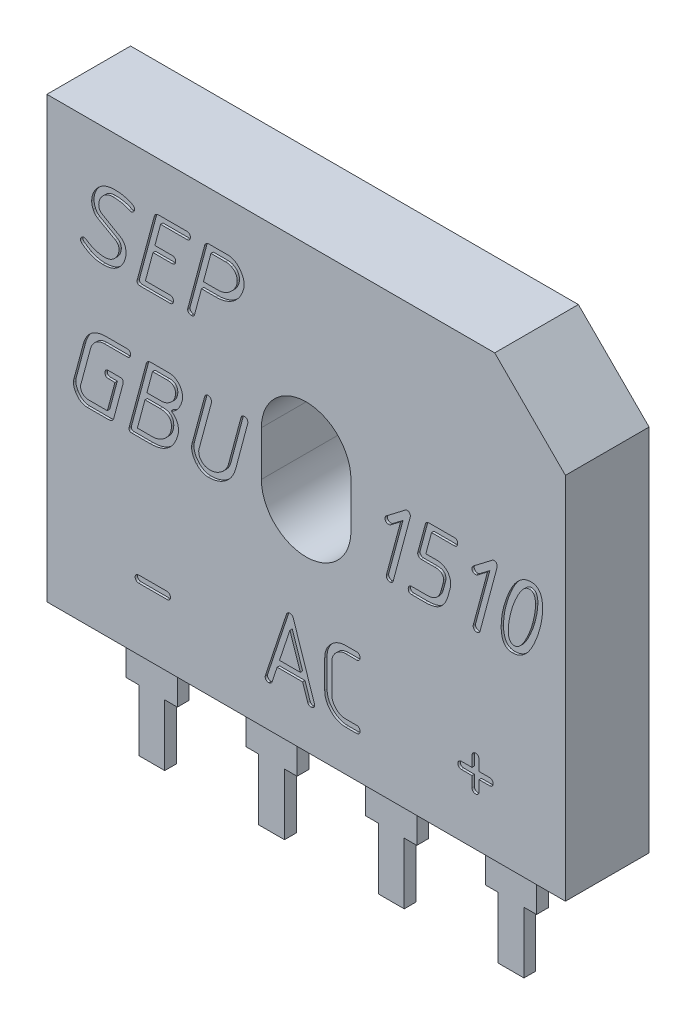
from build123d import *

# Parameters (mm, degrees)
BOSS_EXTRUDE1_DEPTH   = 1.32
BOSS_EXTRUDE2_START   = -2.23
BOSS_EXTRUDE2_DEPTH   = 2.23
BOSS_EXTRUDE3_DEPTH   = 0.25
BOSS_EXTRUDE3_2_DEPTH = 0.25
BOSS_EXTRUDE3_3_DEPTH = 0.25
BOSS_EXTRUDE3_4_DEPTH = 0.25
CUT_EXTRUDE1_DEPTH    = 0.1


with BuildPart() as part:
    # Sketch1 → Boss-Extrude1 (new body)
    with BuildSketch(Plane.XY):
        Polygon((11, 17.92), (8, 20.92), (-11, 20.92), (-11, 2.27), (-8.705, 2.27), (-6.535, 2.27), (-3.625, 2.27), (-1.455, 2.27), (1.455, 2.27), (3.625, 2.27), (6.535, 2.27), (8.705, 2.27), (11, 2.27), align=None)
        with BuildLine():
            Line((-1.9, 11.32), (-1.9, 13.22))
            ThreePointArc((-1.9, 13.22), (0, 15.12), (1.9, 13.22))
            Line((1.9, 13.22), (1.9, 11.32))
            ThreePointArc((1.9, 11.32), (0, 9.42), (-1.9, 11.32))
        make_face(mode=Mode.SUBTRACT)
    extrude(amount=BOSS_EXTRUDE1_DEPTH)

    # Sketch1<3> → Boss-Extrude2 (add)
    with BuildSketch(Plane.XY.offset(BOSS_EXTRUDE2_START)):
        Polygon((11, 17.92), (8, 20.92), (-11, 20.92), (-11, 2.27), (-8.705, 2.27), (-6.535, 2.27), (-3.625, 2.27), (-1.455, 2.27), (1.455, 2.27), (3.625, 2.27), (6.535, 2.27), (8.705, 2.27), (11, 2.27), align=None)
        with BuildLine():
            Line((-1.9, 11.32), (-1.9, 13.22))
            ThreePointArc((-1.9, 13.22), (0, 15.12), (1.9, 13.22))
            Line((1.9, 13.22), (1.9, 11.32))
            ThreePointArc((1.9, 11.32), (0, 9.42), (-1.9, 11.32))
        make_face(mode=Mode.SUBTRACT)
    extrude(amount=BOSS_EXTRUDE2_DEPTH)

    # Sketch2 → Cut-Extrude1 (cut)
    # profile 1 of 14: a face of its own
    with BuildSketch(Plane.XY.offset(1.32)):
        with BuildLine():
            add(Edge.make_bspline(
                [(-7.362496809, 18.682476747), (-7.350585965, 18.675078436), (-7.327411481, 18.66068382), (-7.301705624, 18.628333958), (-7.28632938, 18.589337109), (-7.284895358, 18.561194463), (-7.284148594, 18.546539247)],
                knots=[0, 0, 0, 0, 1.010937993, 1.966944189, 2.941291074, 4, 4, 4, 4], degree=3))
            add(Edge.make_bspline(
                [(-7.284148594, 18.546539247), (-7.284676971, 18.536450334), (-7.285727474, 18.516391849), (-7.29374967, 18.487225497), (-7.308423523, 18.460611258), (-7.327634886, 18.43701029), (-7.349960996, 18.41676396), (-7.375589833, 18.402356715), (-7.403391292, 18.393151957), (-7.422915986, 18.39228901), (-7.432809309, 18.391851747)],
                knots=[0, 0, 0, 0, 1.016871448, 2.021714423, 3.018711884, 4.059223211, 5.079824485, 6.037423826, 7.005546552, 8, 8, 8, 8], degree=3))
            add(Edge.make_bspline(
                [(-7.432809309, 18.391851747), (-7.443909438, 18.392801434), (-7.466586504, 18.394741602), (-7.487227282, 18.404354799), (-7.497764666, 18.409262461)],
                knots=[0, 0, 0, 0, 0.978974091, 2, 2, 2, 2], degree=3))
            add(Edge.make_bspline(
                [(-7.497764666, 18.409262461), (-7.521508504, 18.42094603), (-7.569616733, 18.444618521), (-7.645705196, 18.475128431), (-7.726851649, 18.499200687), (-7.8123308, 18.520397511), (-7.90252473, 18.536194136), (-7.997552808, 18.54730368), (-8.096963146, 18.555181368), (-8.164936101, 18.555666964), (-8.19955038, 18.555914247)],
                knots=[0, 0, 0, 0, 0.87721178, 1.777349789, 2.713750984, 3.681220577, 4.695965222, 5.747005216, 6.85269385, 8, 8, 8, 8], degree=3))
            add(Edge.make_bspline(
                [(-8.19955038, 18.555914247), (-8.225506695, 18.555023065), (-8.276215143, 18.553282044), (-8.350218095, 18.539323822), (-8.420553731, 18.517267249), (-8.487239754, 18.485786387), (-8.549322562, 18.444023345), (-8.607769544, 18.394215024), (-8.662723346, 18.335570264), (-8.694268468, 18.290923594), (-8.71048788, 18.267967819)],
                knots=[0, 0, 0, 0, 1.016049953, 1.984962614, 2.938927668, 3.897090388, 4.862208648, 5.860804614, 6.900099635, 8, 8, 8, 8], degree=3))
            add(Edge.make_bspline(
                [(-8.71048788, 18.267967819), (-8.724542379, 18.244955639), (-8.752514585, 18.199155258), (-8.778700076, 18.122873387), (-8.797801208, 18.043690966), (-8.799404112, 17.989073013), (-8.800220023, 17.96127139)],
                knots=[0, 0, 0, 0, 0.995746553, 1.981801492, 2.972696842, 4, 4, 4, 4], degree=3))
            add(Edge.make_bspline(
                [(-8.800220023, 17.96127139), (-8.799598758, 17.946299112), (-8.798387058, 17.917097508), (-8.792076022, 17.874631806), (-8.779650892, 17.835340072), (-8.763053662, 17.798917999), (-8.741167647, 17.76569641), (-8.714747671, 17.735156244), (-8.68332666, 17.707754424), (-8.659576322, 17.692459299), (-8.647541451, 17.68470889)],
                knots=[0, 0, 0, 0, 1.083322482, 2.112888509, 3.09306846, 4.053515277, 4.998099411, 5.95922408, 6.96588952, 8, 8, 8, 8], degree=3))
            Line((-8.647541451, 17.68470889), (-7.892184309, 17.250110676))
            add(Edge.make_bspline(
                [(-7.892184309, 17.250110676), (-7.872359633, 17.237027444), (-7.833256895, 17.211221714), (-7.782332368, 17.163779599), (-7.738632564, 17.111117823), (-7.703883577, 17.052103524), (-7.676088183, 16.988085109), (-7.656806321, 16.918454802), (-7.645348009, 16.843348466), (-7.643850978, 16.79144724), (-7.643077166, 16.764619604)],
                knots=[0, 0, 0, 0, 0.994484605, 1.961548959, 2.905881559, 3.854517855, 4.822940002, 5.824446651, 6.875460979, 8, 8, 8, 8], degree=3))
            add(Edge.make_bspline(
                [(-7.643077166, 16.764619604), (-7.643778823, 16.740708093), (-7.645180852, 16.692928873), (-7.654779194, 16.621386663), (-7.671059236, 16.550470519), (-7.693028754, 16.479756618), (-7.722385326, 16.409950665), (-7.757055093, 16.340119484), (-7.798714918, 16.271073251), (-7.830494913, 16.226688948), (-7.846648594, 16.204128533)],
                knots=[0, 0, 0, 0, 0.945742199, 1.88975189, 2.849322778, 3.821083026, 4.814697575, 5.84130332, 6.902740623, 8, 8, 8, 8], degree=3))
            add(Edge.make_bspline(
                [(-7.846648594, 16.204128533), (-7.868643433, 16.176189181), (-7.912176967, 16.1208899), (-7.990817598, 16.050664352), (-8.0759302, 15.989553009), (-8.170150584, 15.940688772), (-8.272078594, 15.901959449), (-8.382685662, 15.876066757), (-8.501220355, 15.858460905), (-8.583186576, 15.856780539), (-8.625443237, 15.855914247)],
                knots=[0, 0, 0, 0, 0.96045936, 1.901000125, 2.841133557, 3.789399632, 4.764222291, 5.783784438, 6.857457766, 8, 8, 8, 8], degree=3))
            add(Edge.make_bspline(
                [(-8.625443237, 15.855914247), (-8.679134467, 15.857490201), (-8.784277266, 15.860576369), (-8.938044885, 15.887753358), (-9.084244078, 15.930955402), (-9.175036578, 15.974341998), (-9.220086094, 15.995869604)],
                knots=[0, 0, 0, 0, 1.044021849, 2.04449366, 3.02971486, 4, 4, 4, 4], degree=3))
            add(Edge.make_bspline(
                [(-9.220086094, 15.995869604), (-9.243467683, 16.008532197), (-9.29190862, 16.034765994), (-9.363745379, 16.081153037), (-9.439628961, 16.131381671), (-9.489687401, 16.168825218), (-9.515398594, 16.188057104)],
                knots=[0, 0, 0, 0, 0.904358051, 1.873608865, 2.907835487, 4, 4, 4, 4], degree=3))
            add(Edge.make_bspline(
                [(-9.515398594, 16.188057104), (-9.524094044, 16.195472905), (-9.540934532, 16.209835096), (-9.558752863, 16.237956526), (-9.570064528, 16.269351592), (-9.571111697, 16.291751133), (-9.571648594, 16.303235676)],
                knots=[0, 0, 0, 0, 1.025877104, 1.986817566, 2.967814599, 4, 4, 4, 4], degree=3))
            add(Edge.make_bspline(
                [(-9.571648594, 16.303235676), (-9.571165112, 16.313118673), (-9.570214141, 16.332557761), (-9.561782541, 16.360244278), (-9.548689519, 16.386089661), (-9.530120205, 16.408980013), (-9.507501552, 16.428434974), (-9.481823639, 16.442781468), (-9.453408745, 16.451144504), (-9.433757729, 16.45208344), (-9.423657523, 16.452566033)],
                knots=[0, 0, 0, 0, 1.011831932, 1.990194681, 2.942752894, 3.969251687, 4.992680187, 5.986995554, 6.965358303, 8, 8, 8, 8], degree=3))
            add(Edge.make_bspline(
                [(-9.423657523, 16.452566033), (-9.40857436, 16.451167755), (-9.377259153, 16.448264693), (-9.350483135, 16.431692066), (-9.336603951, 16.423101747)],
                knots=[0, 0, 0, 0, 0.963312308, 2, 2, 2, 2], degree=3))
            add(Edge.make_bspline(
                [(-9.336603951, 16.423101747), (-9.305423258, 16.401665749), (-9.244162754, 16.359550584), (-9.148417349, 16.304960623), (-9.051090881, 16.25941399), (-8.952576967, 16.22193502), (-8.852901695, 16.191823011), (-8.751745315, 16.171584408), (-8.649251183, 16.157973187), (-8.580398133, 16.156603424), (-8.545755737, 16.155914247)],
                knots=[0, 0, 0, 0, 1.069788828, 2.101807086, 3.112836389, 4.105888989, 5.080612967, 6.053741081, 7.020768534, 8, 8, 8, 8], degree=3))
            add(Edge.make_bspline(
                [(-8.545755737, 16.155914247), (-8.520702554, 16.156617193), (-8.471375025, 16.158001232), (-8.399297239, 16.17100032), (-8.331039699, 16.192738698), (-8.266087047, 16.222333806), (-8.204679614, 16.260917083), (-8.147134581, 16.308346232), (-8.0921394, 16.363263461), (-8.060433654, 16.405490128), (-8.044193237, 16.427119604)],
                knots=[0, 0, 0, 0, 1.011653792, 1.991857953, 2.947476935, 3.899983491, 4.868498258, 5.868667559, 6.908282165, 8, 8, 8, 8], degree=3))
            add(Edge.make_bspline(
                [(-8.044193237, 16.427119604), (-8.028520993, 16.450501287), (-7.997014716, 16.497506026), (-7.966464224, 16.578171722), (-7.94579879, 16.664907805), (-7.944002187, 16.725425169), (-7.943077166, 16.75658389)],
                knots=[0, 0, 0, 0, 0.961019954, 1.931960688, 2.935223629, 4, 4, 4, 4], degree=3))
            add(Edge.make_bspline(
                [(-7.943077166, 16.75658389), (-7.94360358, 16.770460613), (-7.944630185, 16.797522777), (-7.952325059, 16.836879381), (-7.964233152, 16.874218999), (-7.981885122, 16.909033496), (-8.004096846, 16.941758644), (-8.032164927, 16.971151071), (-8.064390333, 16.998905847), (-8.08864045, 17.014883862), (-8.10111288, 17.023101747)],
                knots=[0, 0, 0, 0, 1.023667873, 1.996340765, 2.94984581, 3.907753746, 4.867502045, 5.858424513, 6.898535261, 8, 8, 8, 8], degree=3))
            Line((-8.10111288, 17.023101747), (-8.853121809, 17.451673176))
            add(Edge.make_bspline(
                [(-8.853121809, 17.451673176), (-8.871404999, 17.46431131), (-8.908676634, 17.49007508), (-8.957798076, 17.53985792), (-9.000890523, 17.599620903), (-9.024420226, 17.644209905), (-9.036603951, 17.667298176)],
                knots=[0, 0, 0, 0, 0.928354314, 1.892518883, 2.908742214, 4, 4, 4, 4], degree=3))
            add(Edge.make_bspline(
                [(-9.036603951, 17.667298176), (-9.046603608, 17.690517942), (-9.066405897, 17.736499973), (-9.084892948, 17.808563032), (-9.098028499, 17.880881338), (-9.099488036, 17.929514722), (-9.100220023, 17.953905319)],
                knots=[0, 0, 0, 0, 1.0243121, 2.028442119, 3.011224996, 4, 4, 4, 4], degree=3))
            add(Edge.make_bspline(
                [(-9.100220023, 17.953905319), (-9.099410765, 17.980286801), (-9.097798506, 18.032845824), (-9.085923572, 18.11086268), (-9.067271713, 18.187880189), (-9.040274359, 18.263021584), (-9.006637711, 18.337333425), (-8.963858012, 18.40904961), (-8.915237501, 18.480874292), (-8.877222396, 18.525671624), (-8.857809309, 18.548548176)],
                knots=[0, 0, 0, 0, 0.963894814, 1.920338285, 2.877998716, 3.855911688, 4.834232917, 5.854251535, 6.904235471, 8, 8, 8, 8], degree=3))
            add(Edge.make_bspline(
                [(-8.857809309, 18.548548176), (-8.834503993, 18.573273283), (-8.788407221, 18.622178333), (-8.709660434, 18.684195718), (-8.626238668, 18.738130404), (-8.53573852, 18.780773864), (-8.439453274, 18.814467023), (-8.337299968, 18.838229515), (-8.229258789, 18.853621284), (-8.155185609, 18.855136768), (-8.117184309, 18.855914247)],
                knots=[0, 0, 0, 0, 0.984347077, 1.946990296, 2.89894834, 3.860436827, 4.841285433, 5.852666943, 6.898367146, 8, 8, 8, 8], degree=3))
            add(Edge.make_bspline(
                [(-8.117184309, 18.855914247), (-8.070052333, 18.854774004), (-7.97689876, 18.85252038), (-7.839286605, 18.837954957), (-7.706284216, 18.811899996), (-7.620586438, 18.786703224), (-7.578121809, 18.774217819)],
                knots=[0, 0, 0, 0, 1.033347142, 2.04234978, 3.029952788, 4, 4, 4, 4], degree=3))
            add(Edge.make_bspline(
                [(-7.578121809, 18.774217819), (-7.539730153, 18.761419837), (-7.46537754, 18.736634156), (-7.396034745, 18.70013144), (-7.362496809, 18.682476747)],
                knots=[0, 0, 0, 0, 1.032691515, 2, 2, 2, 2], degree=3))
        make_face()
    # profile 2 of 14: a face of its own
    with BuildSketch(Plane.XY.offset(1.32)):
        with BuildLine():
            Line((-5.688389666, 17.355914247), (-6.498657523, 17.355914247))
            Line((-6.498657523, 17.355914247), (-6.820755737, 16.155914247))
            Line((-6.820755737, 16.155914247), (-5.782139666, 16.155914247))
            add(Edge.make_bspline(
                [(-5.782139666, 16.155914247), (-5.770476464, 16.15570083), (-5.748222532, 16.155293621), (-5.717515701, 16.147645771), (-5.690672255, 16.136572816), (-5.669788757, 16.118947087), (-5.651942142, 16.0979186), (-5.641359786, 16.070883798), (-5.633266923, 16.040096024), (-5.632968608, 16.017813252), (-5.632809309, 16.005914247)],
                knots=[0, 0, 0, 0, 1.149127283, 2.192588307, 3.111010819, 3.989618166, 4.868225514, 5.806829786, 6.828846735, 8, 8, 8, 8], degree=3))
            add(Edge.make_bspline(
                [(-5.632809309, 16.005914247), (-5.633028434, 15.994256556), (-5.633446536, 15.972013139), (-5.641021371, 15.941235831), (-5.652400218, 15.914459317), (-5.669282239, 15.892782467), (-5.691129581, 15.876234613), (-5.717177843, 15.863707572), (-5.748398247, 15.857685746), (-5.770515158, 15.85652456), (-5.782139666, 15.855914247)],
                knots=[0, 0, 0, 0, 1.150761667, 2.195706787, 3.115435556, 4.012597447, 4.878756051, 5.807725904, 6.847754709, 8, 8, 8, 8], degree=3))
            Line((-5.782139666, 15.855914247), (-7.056470023, 15.855914247))
            add(Edge.make_bspline(
                [(-7.056470023, 15.855914247), (-7.0668309, 15.85627289), (-7.086629491, 15.856958221), (-7.113988974, 15.866482432), (-7.13837696, 15.879492294), (-7.157136512, 15.899509202), (-7.170367978, 15.922800734), (-7.178330106, 15.948635663), (-7.178851318, 15.976851009), (-7.174121049, 15.995498032), (-7.171648594, 16.005244604)],
                knots=[0, 0, 0, 0, 1.106979366, 2.115325975, 3.081760883, 4.04819579, 5.014630698, 5.940051079, 6.923289682, 8, 8, 8, 8], degree=3))
            Line((-7.171648594, 16.005244604), (-6.45111288, 18.689842819))
            add(Edge.make_bspline(
                [(-6.45111288, 18.689842819), (-6.447686469, 18.70290883), (-6.441088398, 18.728069409), (-6.425755706, 18.762235089), (-6.406605678, 18.791267283), (-6.383685001, 18.815280515), (-6.356230139, 18.83330044), (-6.325689428, 18.847334806), (-6.290922237, 18.854262914), (-6.266761176, 18.855350516), (-6.25423788, 18.855914247)],
                knots=[0, 0, 0, 0, 1.14719896, 2.209104966, 3.167211099, 4.093387276, 5.009393981, 5.94408868, 6.934368591, 8, 8, 8, 8], degree=3))
            Line((-6.25423788, 18.855914247), (-5.06361288, 18.855914247))
            add(Edge.make_bspline(
                [(-5.06361288, 18.855914247), (-5.051949678, 18.85570083), (-5.029695747, 18.855293621), (-4.998988916, 18.847645771), (-4.97214547, 18.836572816), (-4.951261971, 18.818947087), (-4.933415356, 18.7979186), (-4.922833001, 18.770883798), (-4.914740137, 18.740096024), (-4.914441823, 18.717813252), (-4.914282523, 18.705914247)],
                knots=[0, 0, 0, 0, 1.149127283, 2.192588307, 3.111010819, 3.989618166, 4.868225514, 5.806829786, 6.828846735, 8, 8, 8, 8], degree=3))
            add(Edge.make_bspline(
                [(-4.914282523, 18.705914247), (-4.914507076, 18.694261136), (-4.914935534, 18.672026459), (-4.922440952, 18.641190569), (-4.933992109, 18.614730193), (-4.950064951, 18.592328439), (-4.972587929, 18.57647566), (-4.998413851, 18.563781464), (-5.029419054, 18.557623508), (-5.051318571, 18.556506941), (-5.062943237, 18.555914247)],
                knots=[0, 0, 0, 0, 1.153275105, 2.200502544, 3.12224014, 4.007902141, 4.893564142, 5.824563006, 6.84523803, 8, 8, 8, 8], degree=3))
            Line((-5.062943237, 18.555914247), (-6.176559309, 18.555914247))
            Line((-6.176559309, 18.555914247), (-6.41830038, 17.655914247))
            Line((-6.41830038, 17.655914247), (-5.688389666, 17.655914247))
            add(Edge.make_bspline(
                [(-5.688389666, 17.655914247), (-5.676725497, 17.655720932), (-5.654687388, 17.655355684), (-5.624195914, 17.647576933), (-5.597577827, 17.636342381), (-5.576015791, 17.619403565), (-5.558985636, 17.597637443), (-5.548226642, 17.570929361), (-5.540202568, 17.540082212), (-5.539893822, 17.517808443), (-5.539728951, 17.505914247)],
                knots=[0, 0, 0, 0, 1.151695947, 2.175997428, 3.096472906, 3.994363184, 4.861225005, 5.801927355, 6.826228836, 8, 8, 8, 8], degree=3))
            add(Edge.make_bspline(
                [(-5.539728951, 17.505914247), (-5.539953505, 17.494261136), (-5.540381963, 17.472026459), (-5.547887381, 17.441190569), (-5.559438538, 17.414730193), (-5.575511379, 17.392328439), (-5.598034357, 17.37647566), (-5.623860279, 17.363781464), (-5.654865483, 17.357623508), (-5.676764999, 17.356506941), (-5.688389666, 17.355914247)],
                knots=[0, 0, 0, 0, 1.153275105, 2.200502544, 3.12224014, 4.007902141, 4.893564142, 5.824563006, 6.84523803, 8, 8, 8, 8], degree=3))
        make_face()
    # profile 3 of 14: a face of its own
    with BuildSketch(Plane.XY.offset(1.32)):
        with BuildLine():
            Line((-3.820755737, 17.055914247), (-4.44017538, 17.055914247))
            Line((-4.44017538, 17.055914247), (-4.732809309, 15.965735676))
            add(Edge.make_bspline(
                [(-4.732809309, 15.965735676), (-4.738627209, 15.949072003), (-4.749542387, 15.917808671), (-4.782582715, 15.881163502), (-4.826229882, 15.858790088), (-4.858868061, 15.856908441), (-4.87611288, 15.855914247)],
                knots=[0, 0, 0, 0, 1.073282453, 2.013624863, 2.950472122, 4, 4, 4, 4], degree=3))
            add(Edge.make_bspline(
                [(-4.87611288, 15.855914247), (-4.885793192, 15.85634479), (-4.905114808, 15.857204142), (-4.932780872, 15.866835435), (-4.959569886, 15.879960789), (-4.982968445, 15.899453091), (-5.003144433, 15.921891351), (-5.017916755, 15.946658708), (-5.027516069, 15.973089836), (-5.028362742, 15.991324212), (-5.028791451, 16.000557104)],
                knots=[0, 0, 0, 0, 0.998510202, 1.99299684, 3.006387205, 4.07523373, 5.123628012, 6.118920664, 7.04752407, 8, 8, 8, 8], degree=3))
            add(Edge.make_bspline(
                [(-5.028791451, 16.000557104), (-5.028296486, 16.007725547), (-5.027251842, 16.022854837), (-5.023872953, 16.03764223), (-5.022095023, 16.045423176)],
                knots=[0, 0, 0, 0, 0.94762438, 2, 2, 2, 2], degree=3))
            Line((-5.022095023, 16.045423176), (-4.312943237, 18.689842819))
            add(Edge.make_bspline(
                [(-4.312943237, 18.689842819), (-4.309499356, 18.702896934), (-4.302867641, 18.728034607), (-4.287714543, 18.762472661), (-4.267689557, 18.791064362), (-4.244888271, 18.815309403), (-4.217379286, 18.833292745), (-4.186853405, 18.847336361), (-4.151862104, 18.854309018), (-4.127476052, 18.855363203), (-4.114728951, 18.855914247)],
                knots=[0, 0, 0, 0, 1.142971286, 2.200963942, 3.166157351, 4.088920371, 5.001551396, 5.932801545, 6.919432063, 8, 8, 8, 8], degree=3))
            Line((-4.114728951, 18.855914247), (-3.336603951, 18.855914247))
            add(Edge.make_bspline(
                [(-3.336603951, 18.855914247), (-3.305476035, 18.854858548), (-3.244193217, 18.852780149), (-3.155097406, 18.833269682), (-3.07094986, 18.802266783), (-2.991914086, 18.758743245), (-2.917462723, 18.703407671), (-2.849187899, 18.634635435), (-2.784780102, 18.554475136), (-2.748192055, 18.494107112), (-2.72923788, 18.46283389)],
                knots=[0, 0, 0, 0, 0.980464914, 1.930281893, 2.861236577, 3.799955865, 4.76570597, 5.776110108, 6.847929777, 8, 8, 8, 8], degree=3))
            add(Edge.make_bspline(
                [(-2.72923788, 18.46283389), (-2.713692861, 18.433961672), (-2.683199084, 18.37732469), (-2.651974541, 18.287251917), (-2.632102079, 18.196078547), (-2.629893448, 18.134586686), (-2.628791451, 18.103905319)],
                knots=[0, 0, 0, 0, 1.042335879, 2.044690831, 3.024398399, 4, 4, 4, 4], degree=3))
            add(Edge.make_bspline(
                [(-2.628791451, 18.103905319), (-2.629466596, 18.077677861), (-2.630751773, 18.027752308), (-2.641683066, 17.979037595), (-2.646871809, 17.955914247)],
                knots=[0, 0, 0, 0, 1.050662684, 2, 2, 2, 2], degree=3))
            add(Edge.make_bspline(
                [(-2.646871809, 17.955914247), (-2.660670121, 17.910050651), (-2.687667863, 17.820314056), (-2.743190905, 17.693775453), (-2.808846509, 17.57826818), (-2.884466587, 17.472965711), (-2.971034007, 17.378942838), (-3.068701761, 17.296093347), (-3.175814716, 17.222772081), (-3.254154616, 17.184439122), (-3.293746809, 17.165066033)],
                knots=[0, 0, 0, 0, 1.086489717, 2.125823045, 3.128949007, 4.097975082, 5.062645604, 6.022298855, 7.000489841, 8, 8, 8, 8], degree=3))
            add(Edge.make_bspline(
                [(-3.293746809, 17.165066033), (-3.334484004, 17.148248035), (-3.416254753, 17.11448969), (-3.546149194, 17.08113292), (-3.681397694, 17.059364341), (-3.773792145, 17.057076927), (-3.820755737, 17.055914247)],
                knots=[0, 0, 0, 0, 0.974548617, 1.95618695, 2.961141038, 4, 4, 4, 4], degree=3))
        make_face()
        with BuildLine():
            add(Edge.make_bspline(
                [(-3.734371809, 17.355914247), (-3.705526145, 17.356827152), (-3.64815897, 17.358642704), (-3.563507206, 17.372845345), (-3.481678457, 17.397498783), (-3.402447095, 17.430853043), (-3.326185803, 17.474513791), (-3.252434041, 17.526748754), (-3.181374399, 17.58900582), (-3.13795349, 17.636285482), (-3.115621809, 17.660601747)],
                knots=[0, 0, 0, 0, 0.971836052, 1.932751099, 2.882411051, 3.846471588, 4.82338936, 5.837790081, 6.887960099, 8, 8, 8, 8], degree=3))
            add(Edge.make_bspline(
                [(-3.115621809, 17.660601747), (-3.100822558, 17.678008025), (-3.071695365, 17.712266247), (-3.033899245, 17.766426779), (-3.001219593, 17.820835874), (-2.975156198, 17.876140918), (-2.95388439, 17.931965869), (-2.939403663, 17.988812773), (-2.930168617, 18.046235072), (-2.929250693, 18.084674114), (-2.928791451, 18.103905319)],
                knots=[0, 0, 0, 0, 1.113829173, 2.192186583, 3.217289793, 4.205896502, 5.170531583, 6.126464125, 7.062662637, 8, 8, 8, 8], degree=3))
            add(Edge.make_bspline(
                [(-2.928791451, 18.103905319), (-2.929651596, 18.125372278), (-2.931329175, 18.16724026), (-2.941810866, 18.228015116), (-2.960761485, 18.28415322), (-2.987248661, 18.335786864), (-3.02116095, 18.383095983), (-3.062329546, 18.426213746), (-3.111142687, 18.464799221), (-3.147697724, 18.486047821), (-3.166514666, 18.496985676)],
                knots=[0, 0, 0, 0, 1.062400615, 2.072047982, 3.03955272, 3.983054393, 4.933191678, 5.909732848, 6.924021465, 8, 8, 8, 8], degree=3))
            add(Edge.make_bspline(
                [(-3.166514666, 18.496985676), (-3.185479019, 18.506282179), (-3.223313915, 18.524829198), (-3.284721472, 18.542202706), (-3.348166033, 18.554414109), (-3.391676667, 18.555411437), (-3.41361288, 18.555914247)],
                knots=[0, 0, 0, 0, 0.986137637, 1.967397217, 2.975248071, 4, 4, 4, 4], degree=3))
            Line((-3.41361288, 18.555914247), (-4.038389666, 18.555914247))
            Line((-4.038389666, 18.555914247), (-4.359818237, 17.355914247))
            Line((-4.359818237, 17.355914247), (-3.734371809, 17.355914247))
        make_face(mode=Mode.SUBTRACT)
    # profile 4 of 14: a face of its own
    with BuildSketch(Plane.XY.offset(1.32)):
        with BuildLine():
            Line((-7.600189125, 12.975854172), (-8.566483767, 12.975854172))
            add(Edge.make_bspline(
                [(-8.566483767, 12.975854172), (-8.58885012, 12.975282139), (-8.632957187, 12.974154074), (-8.697703771, 12.963048981), (-8.75980515, 12.945014769), (-8.818955633, 12.919183829), (-8.875749339, 12.886923052), (-8.929519793, 12.846968141), (-8.980628996, 12.799969175), (-9.011465308, 12.764343142), (-9.027198053, 12.746166672)],
                knots=[0, 0, 0, 0, 1.005917498, 1.983697198, 2.9469689, 3.909978608, 4.881960327, 5.880627148, 6.918691924, 8, 8, 8, 8], degree=3))
            add(Edge.make_bspline(
                [(-9.027198053, 12.746166672), (-9.041245762, 12.727936503), (-9.068860277, 12.692100247), (-9.102321598, 12.633977759), (-9.128844246, 12.574215223), (-9.141025831, 12.532927324), (-9.147064125, 12.512461315)],
                knots=[0, 0, 0, 0, 1.042657897, 2.049621998, 3.033216614, 4, 4, 4, 4], degree=3))
            Line((-9.147064125, 12.512461315), (-9.547510553, 11.021166672))
            add(Edge.make_bspline(
                [(-9.547510553, 11.021166672), (-9.55503417, 11.002435609), (-9.569311679, 10.966889813), (-9.57224095, 10.928727881), (-9.573626625, 10.9106756)],
                knots=[0, 0, 0, 0, 1.053911558, 2, 2, 2, 2], degree=3))
            add(Edge.make_bspline(
                [(-9.573626625, 10.9106756), (-9.5724142, 10.886639431), (-9.570070373, 10.840173365), (-9.54976304, 10.774195105), (-9.517371828, 10.715351389), (-9.471659426, 10.665653767), (-9.416725326, 10.625530275), (-9.354226899, 10.596294828), (-9.284999508, 10.579336095), (-9.236890807, 10.577040799), (-9.212019482, 10.575854172)],
                knots=[0, 0, 0, 0, 1.042556362, 2.015441517, 2.970903077, 3.939328102, 4.925043067, 5.910232762, 6.91962826, 8, 8, 8, 8], degree=3))
            Line((-9.212019482, 10.575854172), (-8.435233767, 10.575854172))
            Line((-8.435233767, 10.575854172), (-8.113135553, 11.775854172))
            Line((-8.113135553, 11.775854172), (-8.386349839, 11.775854172))
            add(Edge.make_bspline(
                [(-8.386349839, 11.775854172), (-8.397974346, 11.776464484), (-8.420091257, 11.777625671), (-8.451311661, 11.783647497), (-8.477359923, 11.796174538), (-8.499207266, 11.812722392), (-8.516089286, 11.834399241), (-8.527468134, 11.861175755), (-8.535042968, 11.891953063), (-8.53546107, 11.91419648), (-8.535680196, 11.925854172)],
                knots=[0, 0, 0, 0, 1.152245291, 2.192274096, 3.121243949, 3.987402553, 4.884564444, 5.804293213, 6.849238333, 8, 8, 8, 8], degree=3))
            add(Edge.make_bspline(
                [(-8.535680196, 11.925854172), (-8.535520896, 11.937753176), (-8.535222582, 11.960035949), (-8.527129718, 11.990823723), (-8.516547363, 12.017858525), (-8.498700748, 12.038887012), (-8.477817249, 12.056512741), (-8.450973803, 12.067585696), (-8.420266972, 12.075233546), (-8.398013041, 12.075640755), (-8.386349839, 12.075854172)],
                knots=[0, 0, 0, 0, 1.171153265, 2.193170214, 3.131774486, 4.010381834, 4.888989181, 5.807411693, 6.850872717, 8, 8, 8, 8], degree=3))
            Line((-8.386349839, 12.075854172), (-7.880099839, 12.075854172))
            add(Edge.make_bspline(
                [(-7.880099839, 12.075854172), (-7.870917066, 12.075461999), (-7.853496708, 12.074718021), (-7.82924786, 12.06941046), (-7.808354047, 12.060907076), (-7.791568739, 12.047555364), (-7.779034859, 12.030487), (-7.769082521, 12.010445601), (-7.764082379, 11.986354056), (-7.763319545, 11.96917581), (-7.762912339, 11.960005957)],
                knots=[0, 0, 0, 0, 1.166605749, 2.213132211, 3.140964779, 4.009626243, 4.900711416, 5.814551362, 6.833394251, 8, 8, 8, 8], degree=3))
            add(Edge.make_bspline(
                [(-7.762912339, 11.960005957), (-7.762945441, 11.950620439), (-7.762996734, 11.936077298), (-7.764417428, 11.921609924), (-7.764921267, 11.916479172)],
                knots=[0, 0, 0, 0, 1.290714124, 2, 2, 2, 2], degree=3))
            Line((-7.764921267, 11.916479172), (-8.165367696, 10.425184529))
            add(Edge.make_bspline(
                [(-8.165367696, 10.425184529), (-8.169098901, 10.413474367), (-8.176317363, 10.390819658), (-8.191440926, 10.359668561), (-8.211273611, 10.333736156), (-8.234577945, 10.312723512), (-8.260902418, 10.295240152), (-8.291772326, 10.284489725), (-8.325667713, 10.276427772), (-8.349686486, 10.276051089), (-8.362242696, 10.275854172)],
                knots=[0, 0, 0, 0, 1.0951398, 2.118678964, 3.070016712, 3.98571427, 4.907662396, 5.865018045, 6.883902972, 8, 8, 8, 8], degree=3))
            Line((-8.362242696, 10.275854172), (-9.288358767, 10.275854172))
            add(Edge.make_bspline(
                [(-9.288358767, 10.275854172), (-9.313880661, 10.276912049), (-9.364281228, 10.279001142), (-9.437681871, 10.294720182), (-9.507016512, 10.320672004), (-9.572641171, 10.356146661), (-9.633273032, 10.403521482), (-9.690364487, 10.460123251), (-9.743872938, 10.526964415), (-9.774204282, 10.577251796), (-9.789921267, 10.603309529)],
                knots=[0, 0, 0, 0, 0.971726617, 1.918963066, 2.844502726, 3.784383078, 4.748677999, 5.764813957, 6.841779396, 8, 8, 8, 8], degree=3))
            add(Edge.make_bspline(
                [(-9.789921267, 10.603309529), (-9.802888606, 10.627100547), (-9.828342976, 10.673801372), (-9.854067874, 10.747942426), (-9.870373816, 10.822463064), (-9.872545886, 10.872424076), (-9.873626625, 10.897282743)],
                knots=[0, 0, 0, 0, 1.050303479, 2.061704027, 3.035578921, 4, 4, 4, 4], degree=3))
            add(Edge.make_bspline(
                [(-9.873626625, 10.897282743), (-9.872964968, 10.918796155), (-9.871673269, 10.960795068), (-9.862633904, 11.001823956), (-9.858224839, 11.021836315)],
                knots=[0, 0, 0, 0, 1.024474716, 2, 2, 2, 2], degree=3))
            Line((-9.858224839, 11.021836315), (-9.45777841, 12.513130957))
            add(Edge.make_bspline(
                [(-9.45777841, 12.513130957), (-9.446335325, 12.553591458), (-9.424098267, 12.632217325), (-9.37776705, 12.742527626), (-9.324498188, 12.843309077), (-9.261708977, 12.933219867), (-9.191796965, 13.014305383), (-9.112250444, 13.083928083), (-9.024630339, 13.143882152), (-8.960897034, 13.174633845), (-8.928760553, 13.190139886)],
                knots=[0, 0, 0, 0, 1.132153827, 2.200085861, 3.217367295, 4.198509914, 5.149159901, 6.095288907, 7.039580471, 8, 8, 8, 8], degree=3))
            add(Edge.make_bspline(
                [(-8.928760553, 13.190139886), (-8.894867885, 13.203434401), (-8.826465094, 13.23026563), (-8.717743444, 13.256276758), (-8.603840039, 13.273001642), (-8.525921597, 13.274889827), (-8.486126625, 13.275854172)],
                knots=[0, 0, 0, 0, 0.961648342, 1.940815927, 2.948321227, 4, 4, 4, 4], degree=3))
            Line((-8.486126625, 13.275854172), (-7.600189125, 13.275854172))
            add(Edge.make_bspline(
                [(-7.600189125, 13.275854172), (-7.588525923, 13.275640755), (-7.566271991, 13.275233546), (-7.53556516, 13.267585696), (-7.508721714, 13.256512741), (-7.487838216, 13.238887012), (-7.4699916, 13.217858525), (-7.459409245, 13.190823723), (-7.451316382, 13.160035949), (-7.451018067, 13.137753176), (-7.450858767, 13.125854172)],
                knots=[0, 0, 0, 0, 1.149127283, 2.192588307, 3.111010819, 3.989618166, 4.868225514, 5.806829786, 6.828846735, 8, 8, 8, 8], degree=3))
            add(Edge.make_bspline(
                [(-7.450858767, 13.125854172), (-7.451077893, 13.11419648), (-7.451495995, 13.091953063), (-7.45907083, 13.061175755), (-7.470449677, 13.034399241), (-7.487331698, 13.012722392), (-7.50917904, 12.996174538), (-7.535227302, 12.983647497), (-7.566447706, 12.977625671), (-7.588564617, 12.976464484), (-7.600189125, 12.975854172)],
                knots=[0, 0, 0, 0, 1.150761667, 2.195706787, 3.115435556, 4.012597447, 4.878756051, 5.807725904, 6.847754709, 8, 8, 8, 8], degree=3))
        make_face()
    # profile 5 of 14: a face of its own
    with BuildSketch(Plane.XY.offset(1.32)):
        with BuildLine():
            add(Edge.make_bspline(
                [(-5.724519482, 11.9278631), (-5.6999918, 11.910315987), (-5.652326355, 11.876216108), (-5.589220955, 11.817169916), (-5.536011295, 11.753218792), (-5.491925171, 11.684570083), (-5.458098584, 11.610557685), (-5.434296464, 11.531935578), (-5.418777868, 11.448559351), (-5.417260777, 11.391327418), (-5.416483767, 11.362014886)],
                knots=[0, 0, 0, 0, 1.074275303, 2.087674302, 3.070880147, 4.03335445, 4.987635646, 5.961750569, 6.956067885, 8, 8, 8, 8], degree=3))
            add(Edge.make_bspline(
                [(-5.416483767, 11.362014886), (-5.417440193, 11.33062494), (-5.419356608, 11.267728039), (-5.433950188, 11.206516752), (-5.441260553, 11.175854172)],
                knots=[0, 0, 0, 0, 0.998139658, 2, 2, 2, 2], degree=3))
            add(Edge.make_bspline(
                [(-5.441260553, 11.175854172), (-5.452199759, 11.139325915), (-5.473559216, 11.068002303), (-5.51245667, 10.965525496), (-5.557378158, 10.87057579), (-5.607018428, 10.7822202), (-5.661834383, 10.700898811), (-5.722528143, 10.626873637), (-5.78812771, 10.559523762), (-5.859689328, 10.499747476), (-5.936118604, 10.446442884), (-6.018304767, 10.401164296), (-6.105163509, 10.361652398), (-6.197797672, 10.330768963), (-6.295281408, 10.305566661), (-6.398160486, 10.288682588), (-6.506189346, 10.277462554), (-6.580069893, 10.276398107), (-6.617823053, 10.275854172)],
                knots=[0, 0, 0, 0, 1.134376938, 2.214939054, 3.257794376, 4.25710064, 5.227924905, 6.171909395, 7.101863511, 8.021154332, 8.942362642, 9.87003699, 10.80945407, 11.777730355, 12.771658551, 13.802430282, 14.87703591, 16, 16, 16, 16], degree=3))
            Line((-6.617823053, 10.275854172), (-7.395948053, 10.275854172))
            add(Edge.make_bspline(
                [(-7.395948053, 10.275854172), (-7.405350724, 10.276251244), (-7.423206572, 10.277005293), (-7.448143676, 10.282264916), (-7.469453469, 10.29087286), (-7.487039549, 10.303375855), (-7.500608729, 10.319762364), (-7.510118747, 10.339777743), (-7.515366206, 10.36331399), (-7.516094477, 10.380068081), (-7.516483767, 10.389023815)],
                knots=[0, 0, 0, 0, 1.190861071, 2.261467448, 3.21217283, 4.083416904, 4.966967938, 5.877711498, 6.865551585, 8, 8, 8, 8], degree=3))
            add(Edge.make_bspline(
                [(-7.516483767, 10.389023815), (-7.516257388, 10.395526497), (-7.51583246, 10.40773241), (-7.513081607, 10.41962684), (-7.511796267, 10.425184529)],
                knots=[0, 0, 0, 0, 1.065497166, 2, 2, 2, 2], degree=3))
            Line((-7.511796267, 10.425184529), (-6.791260553, 13.109782743))
            add(Edge.make_bspline(
                [(-6.791260553, 13.109782743), (-6.787834738, 13.12284965), (-6.781237813, 13.148011953), (-6.765897268, 13.182165826), (-6.746773545, 13.211237567), (-6.72388893, 13.234977823), (-6.696965896, 13.253451605), (-6.666675942, 13.267114897), (-6.632211122, 13.274286334), (-6.608254961, 13.275315745), (-6.595724839, 13.275854172)],
                knots=[0, 0, 0, 0, 1.152126522, 2.218593732, 3.180815217, 4.110969598, 5.015173959, 5.953883452, 6.929791385, 8, 8, 8, 8], degree=3))
            Line((-6.595724839, 13.275854172), (-5.828314125, 13.275854172))
            add(Edge.make_bspline(
                [(-5.828314125, 13.275854172), (-5.80819034, 13.275412163), (-5.768416989, 13.274538563), (-5.710117793, 13.265420976), (-5.654224882, 13.25148174), (-5.601026418, 13.231937391), (-5.550197835, 13.206954146), (-5.50205366, 13.176006775), (-5.456036092, 13.139466243), (-5.413304261, 13.097684344), (-5.373901776, 13.052576599), (-5.339528228, 13.004517559), (-5.30975644, 12.954591125), (-5.286605725, 12.901730069), (-5.267255016, 12.847536754), (-5.255008825, 12.790556992), (-5.246488565, 12.73169194), (-5.245536994, 12.691511019), (-5.245055196, 12.671166672)],
                knots=[0, 0, 0, 0, 1.032633716, 2.040933432, 3.022290984, 3.986904278, 4.94550576, 5.924853018, 6.920168948, 7.957752937, 8.989686628, 9.991712185, 10.9884132, 11.96836398, 12.950725137, 13.937889392, 14.955915071, 16, 16, 16, 16], degree=3))
            add(Edge.make_bspline(
                [(-5.245055196, 12.671166672), (-5.245477941, 12.645607694), (-5.246289237, 12.596557156), (-5.257227362, 12.548750166), (-5.26246591, 12.525854172)],
                knots=[0, 0, 0, 0, 1.042148702, 2, 2, 2, 2], degree=3))
            add(Edge.make_bspline(
                [(-5.26246591, 12.525854172), (-5.273627305, 12.48746397), (-5.295080979, 12.413672931), (-5.336933153, 12.310237613), (-5.385052526, 12.218218386), (-5.439146481, 12.136515378), (-5.501476197, 12.067495002), (-5.568541687, 12.008040283), (-5.643313158, 11.960898142), (-5.697358699, 11.93891221), (-5.724519482, 11.9278631)],
                knots=[0, 0, 0, 0, 1.218539051, 2.342193026, 3.395622322, 4.381065152, 5.321080488, 6.223272455, 7.107099118, 8, 8, 8, 8], degree=3))
        make_face()
        with BuildLine():
            Line((-6.516706982, 12.975854172), (-6.75777841, 12.075854172))
            Line((-6.75777841, 12.075854172), (-6.142376625, 12.075854172))
            add(Edge.make_bspline(
                [(-6.142376625, 12.075854172), (-6.111196487, 12.077659015), (-6.048322115, 12.081298459), (-5.95483905, 12.107381247), (-5.863282108, 12.15070984), (-5.7747341, 12.207766574), (-5.695118663, 12.275828358), (-5.63126314, 12.352889233), (-5.584396051, 12.436082791), (-5.568825143, 12.49615397), (-5.561126625, 12.525854172)],
                knots=[0, 0, 0, 0, 0.950033093, 1.915730316, 2.935697092, 4.028626626, 5.118841013, 6.114756008, 7.067903653, 8, 8, 8, 8], degree=3))
            add(Edge.make_bspline(
                [(-5.561126625, 12.525854172), (-5.556465963, 12.549660974), (-5.548230813, 12.591726371), (-5.546016378, 12.634514162), (-5.545055196, 12.653086315)],
                knots=[0, 0, 0, 0, 1.131894773, 2, 2, 2, 2], degree=3))
            add(Edge.make_bspline(
                [(-5.545055196, 12.653086315), (-5.545899904, 12.678410199), (-5.547498765, 12.726343158), (-5.564292921, 12.793519267), (-5.592789663, 12.850564062), (-5.632536502, 12.897913796), (-5.684985368, 12.933148297), (-5.747574673, 12.958666403), (-5.821443294, 12.972908084), (-5.874011948, 12.974831205), (-5.901974839, 12.975854172)],
                knots=[0, 0, 0, 0, 1.101043315, 2.084050963, 2.988165931, 3.856844956, 4.743871749, 5.711332392, 6.782586989, 8, 8, 8, 8], degree=3))
            Line((-5.901974839, 12.975854172), (-6.516706982, 12.975854172))
        make_face(mode=Mode.SUBTRACT)
        with BuildLine():
            Line((-6.838805196, 11.775854172), (-7.16090341, 10.575854172))
            Line((-7.16090341, 10.575854172), (-6.53277841, 10.575854172))
            add(Edge.make_bspline(
                [(-6.53277841, 10.575854172), (-6.506388552, 10.576346026), (-6.454244598, 10.577317887), (-6.377457647, 10.589655681), (-6.302524331, 10.607196422), (-6.230302137, 10.633781685), (-6.160051111, 10.666741219), (-6.091960571, 10.707146621), (-6.026642752, 10.755589999), (-5.964041984, 10.810104716), (-5.906581173, 10.8693976), (-5.855901954, 10.932132119), (-5.81258912, 10.997145651), (-5.777882533, 11.065188648), (-5.74987585, 11.135205918), (-5.730494156, 11.208033468), (-5.718928032, 11.283294861), (-5.717302965, 11.33429616), (-5.716483767, 11.360005957)],
                knots=[0, 0, 0, 0, 1.011757955, 1.999141464, 2.977753035, 3.961413365, 4.946266645, 5.95264287, 6.994384, 8.062971001, 9.135294271, 10.158770915, 11.154296406, 12.127456059, 13.085108622, 14.043067658, 15.013508772, 16, 16, 16, 16], degree=3))
            add(Edge.make_bspline(
                [(-5.716483767, 11.360005957), (-5.716945007, 11.376752544), (-5.717845297, 11.409440137), (-5.722622061, 11.456919249), (-5.733297451, 11.500877413), (-5.746032479, 11.541837382), (-5.764082981, 11.579020246), (-5.784726818, 11.613837095), (-5.810152507, 11.644987476), (-5.839326253, 11.673004898), (-5.872591089, 11.69683485), (-5.908691748, 11.718840412), (-5.949557079, 11.735821958), (-5.993770915, 11.750751827), (-6.042222605, 11.7620385), (-6.094431511, 11.769630157), (-6.150280003, 11.775551042), (-6.18878777, 11.775750949), (-6.208671267, 11.775854172)],
                knots=[0, 0, 0, 0, 1.090173035, 2.127904267, 3.096777638, 4.029147703, 4.912729087, 5.779559164, 6.657392057, 7.520319672, 8.403423443, 9.315088114, 10.264830593, 11.27526865, 12.349752119, 13.495954527, 14.707035355, 16, 16, 16, 16], degree=3))
            Line((-6.208671267, 11.775854172), (-6.838805196, 11.775854172))
        make_face(mode=Mode.SUBTRACT)
    # profile 6 of 14: a face of its own
    with BuildSketch(Plane.XY.offset(1.32)):
        with BuildLine():
            add(Edge.make_bspline(
                [(-2.987689125, 11.171166672), (-2.997695916, 11.137080892), (-3.017420497, 11.069893752), (-3.054945945, 10.973223201), (-3.099464432, 10.882505177), (-3.149574239, 10.797241554), (-3.206147112, 10.71760053), (-3.269378902, 10.643909456), (-3.338366712, 10.57534977), (-3.413338335, 10.51321174), (-3.493223277, 10.457704404), (-3.5768293, 10.408341204), (-3.664807518, 10.367896029), (-3.756000648, 10.33377393), (-3.850898874, 10.308105452), (-3.949319578, 10.288955414), (-4.051523126, 10.278450166), (-4.120925934, 10.276729233), (-4.15621591, 10.275854172)],
                knots=[0, 0, 0, 0, 1.071103048, 2.11127191, 3.122923645, 4.115877367, 5.091006625, 6.065112809, 7.04100867, 8.021075441, 8.99783011, 9.972354954, 10.945204076, 11.914389146, 12.905766876, 13.906585971, 14.935539746, 16, 16, 16, 16], degree=3))
            add(Edge.make_bspline(
                [(-4.15621591, 10.275854172), (-4.179024069, 10.276711261), (-4.223997775, 10.278401292), (-4.290802553, 10.289381161), (-4.355535418, 10.308052018), (-4.418458993, 10.334732797), (-4.479545163, 10.368009416), (-4.538112788, 10.409934412), (-4.595991806, 10.457528411), (-4.631148131, 10.494650297), (-4.649073053, 10.513577386)],
                knots=[0, 0, 0, 0, 0.970563502, 1.913781683, 2.872795178, 3.830726079, 4.817012898, 5.826313837, 6.89171711, 8, 8, 8, 8], degree=3))
            add(Edge.make_bspline(
                [(-4.649073053, 10.513577386), (-4.666016144, 10.532659812), (-4.699256182, 10.570096934), (-4.741073505, 10.631104622), (-4.777769882, 10.692560599), (-4.807076019, 10.755992486), (-4.83129585, 10.82044521), (-4.84674427, 10.887134299), (-4.857541985, 10.955191262), (-4.858737381, 11.001257177), (-4.85934091, 11.024514886)],
                knots=[0, 0, 0, 0, 1.081558567, 2.121870652, 3.132051501, 4.11487645, 5.082483553, 6.047120536, 7.014032336, 8, 8, 8, 8], degree=3))
            add(Edge.make_bspline(
                [(-4.85934091, 11.024514886), (-4.858606936, 11.050065233), (-4.857186072, 11.099526862), (-4.846450474, 11.147820185), (-4.841260553, 11.171166672)],
                knots=[0, 0, 0, 0, 1.033138107, 2, 2, 2, 2], degree=3))
            Line((-4.841260553, 11.171166672), (-4.310233767, 13.148622029))
            add(Edge.make_bspline(
                [(-4.310233767, 13.148622029), (-4.304643783, 13.167603418), (-4.294303388, 13.202715328), (-4.263257608, 13.246275901), (-4.218436859, 13.271954824), (-4.18511502, 13.274510706), (-4.167599839, 13.275854172)],
                knots=[0, 0, 0, 0, 1.133248797, 2.096291795, 2.999341117, 4, 4, 4, 4], degree=3))
            add(Edge.make_bspline(
                [(-4.167599839, 13.275854172), (-4.155959849, 13.275314472), (-4.133763816, 13.27428533), (-4.102597022, 13.26731835), (-4.076268589, 13.254272919), (-4.054956328, 13.236197003), (-4.037434215, 13.213690106), (-4.026589797, 13.18505451), (-4.018840207, 13.15216308), (-4.01846659, 13.128364748), (-4.018269482, 13.115809529)],
                knots=[0, 0, 0, 0, 1.114153469, 2.12455398, 3.032163762, 3.896504344, 4.780939452, 5.729125756, 6.801961183, 8, 8, 8, 8], degree=3))
            add(Edge.make_bspline(
                [(-4.018269482, 13.115809529), (-4.018321537, 13.107093709), (-4.01841515, 13.09141985), (-4.020169327, 13.075847503), (-4.020948053, 13.068934529)],
                knots=[0, 0, 0, 0, 1.112147376, 2, 2, 2, 2], degree=3))
            Line((-4.020948053, 13.068934529), (-4.530546267, 11.171166672))
            add(Edge.make_bspline(
                [(-4.530546267, 11.171166672), (-4.53885003, 11.146842706), (-4.554590023, 11.100736011), (-4.55781656, 11.052154379), (-4.55934091, 11.029202386)],
                knots=[0, 0, 0, 0, 1.055116396, 2, 2, 2, 2], degree=3))
            add(Edge.make_bspline(
                [(-4.55934091, 11.029202386), (-4.559026099, 11.012882673), (-4.558406605, 10.980768374), (-4.551425343, 10.933913503), (-4.540681895, 10.889311001), (-4.526044771, 10.84672376), (-4.506472634, 10.806652061), (-4.483050837, 10.768644477), (-4.454406553, 10.733844585), (-4.412064103, 10.690291833), (-4.350850122, 10.644630333), (-4.268351806, 10.604159169), (-4.176948426, 10.580302498), (-4.113275876, 10.577364428), (-4.080546267, 10.575854172)],
                knots=[0, 0, 0, 0, 0.795202862, 1.564818088, 2.30396931, 3.030267558, 3.755586528, 4.474342875, 5.201863369, 5.948429809, 7.433009403, 8.898191868, 10.405577155, 12, 12, 12, 12], degree=3))
            add(Edge.make_bspline(
                [(-4.080546267, 10.575854172), (-4.059540162, 10.576369785), (-4.017819486, 10.577393855), (-3.955456684, 10.585653875), (-3.893909387, 10.599862423), (-3.832767745, 10.619356525), (-3.772321864, 10.644262103), (-3.712618466, 10.674593909), (-3.6533251, 10.710112335), (-3.596102464, 10.751522349), (-3.540686803, 10.795531124), (-3.490735122, 10.843219583), (-3.445280788, 10.892440716), (-3.404994189, 10.943689383), (-3.370805619, 10.997828824), (-3.341145673, 11.053727714), (-3.315994171, 11.111541413), (-3.304241127, 11.151826688), (-3.29840341, 11.171836315)],
                knots=[0, 0, 0, 0, 0.960884632, 1.908433625, 2.872190539, 3.84761935, 4.841427613, 5.859959834, 6.909112079, 8.00017665, 9.089566965, 10.144321338, 11.156278338, 12.153230245, 13.122168106, 14.081586194, 15.047127194, 16, 16, 16, 16], degree=3))
            Line((-3.29840341, 11.171836315), (-2.76871591, 13.149291672))
            add(Edge.make_bspline(
                [(-2.76871591, 13.149291672), (-2.7632351, 13.168356233), (-2.753108263, 13.203581621), (-2.720794251, 13.246115718), (-2.676314791, 13.272004702), (-2.642950064, 13.274527891), (-2.625412339, 13.275854172)],
                knots=[0, 0, 0, 0, 1.133929125, 2.095148933, 2.998740386, 4, 4, 4, 4], degree=3))
            add(Edge.make_bspline(
                [(-2.625412339, 13.275854172), (-2.613522555, 13.275684217), (-2.591257051, 13.275365949), (-2.560355407, 13.267404663), (-2.533662895, 13.256369795), (-2.511417508, 13.240077508), (-2.49508823, 13.218165939), (-2.48265144, 13.192359821), (-2.476439521, 13.161397066), (-2.475331078, 13.139491159), (-2.474742696, 13.1278631)],
                knots=[0, 0, 0, 0, 1.174906657, 2.200199036, 3.141811411, 4.027116298, 4.894816711, 5.82544018, 6.84570365, 8, 8, 8, 8], degree=3))
            add(Edge.make_bspline(
                [(-2.474742696, 13.1278631), (-2.474904125, 13.119571149), (-2.475189469, 13.104914237), (-2.478146197, 13.090566857), (-2.479430196, 13.084336315)],
                knots=[0, 0, 0, 0, 1.131473155, 2, 2, 2, 2], degree=3))
            Line((-2.479430196, 13.084336315), (-2.987689125, 11.171166672))
        make_face()
    # profile 7 of 14: a face of its own
    with BuildSketch(Plane.XY.offset(1.32)):
        with BuildLine():
            Line((4.008141293, 12.717372029), (3.586266293, 12.394604172))
            add(Edge.make_bspline(
                [(3.586266293, 12.394604172), (3.57755804, 12.388796786), (3.560938362, 12.377713406), (3.532600162, 12.368533685), (3.504037639, 12.362945729), (3.484715302, 12.365305546), (3.475105579, 12.366479172)],
                knots=[0, 0, 0, 0, 1.061998857, 2.026822129, 3.018664615, 4, 4, 4, 4], degree=3))
            add(Edge.make_bspline(
                [(3.475105579, 12.366479172), (3.464971907, 12.368361894), (3.445081141, 12.372057374), (3.417372827, 12.383419019), (3.393297842, 12.400197425), (3.372538785, 12.420772228), (3.356198381, 12.445266922), (3.347145129, 12.473251028), (3.341635419, 12.502949167), (3.343986642, 12.523387331), (3.345194865, 12.533889886)],
                knots=[0, 0, 0, 0, 1.039139227, 2.039662938, 2.996308649, 3.984568072, 4.978723012, 5.934039863, 6.938365452, 8, 8, 8, 8], degree=3))
            add(Edge.make_bspline(
                [(3.345194865, 12.533889886), (3.346763193, 12.543393598), (3.349899848, 12.562401022), (3.362599086, 12.588726861), (3.380385094, 12.613042609), (3.395992148, 12.626161878), (3.404123436, 12.632997029)],
                knots=[0, 0, 0, 0, 0.971078246, 1.942156491, 2.927861806, 4, 4, 4, 4], degree=3))
            Line((3.404123436, 12.632997029), (4.181578793, 13.227639886))
            add(Edge.make_bspline(
                [(4.181578793, 13.227639886), (4.18819897, 13.235121934), (4.200589335, 13.249125384), (4.22297798, 13.264167476), (4.245667674, 13.274475086), (4.26161367, 13.27540555), (4.269302007, 13.275854172)],
                knots=[0, 0, 0, 0, 1.1543037, 2.160402203, 3.11304081, 4, 4, 4, 4], degree=3))
            add(Edge.make_bspline(
                [(4.269302007, 13.275854172), (4.280961288, 13.275635986), (4.303207737, 13.275219677), (4.333964722, 13.267632823), (4.360516829, 13.256416086), (4.381885582, 13.239614416), (4.399262617, 13.218613012), (4.410254295, 13.192026289), (4.41808599, 13.161574518), (4.418443267, 13.139530432), (4.418632365, 13.1278631)],
                knots=[0, 0, 0, 0, 1.157211368, 2.208013116, 3.13289671, 4.003909893, 4.888698223, 5.813581817, 6.842788632, 8, 8, 8, 8], degree=3))
            add(Edge.make_bspline(
                [(4.418632365, 13.1278631), (4.418456597, 13.119795819), (4.418142173, 13.105364544), (4.415229371, 13.091236313), (4.413944865, 13.085005957)],
                knots=[0, 0, 0, 0, 1.11802747, 2, 2, 2, 2], degree=3))
            Line((4.413944865, 13.085005957), (3.69340915, 10.386345243))
            add(Edge.make_bspline(
                [(3.69340915, 10.386345243), (3.687543686, 10.369718207), (3.676483468, 10.338365422), (3.643987361, 10.301322493), (3.600491121, 10.278613673), (3.568031534, 10.27681199), (3.550775222, 10.275854172)],
                knots=[0, 0, 0, 0, 1.073812338, 2.024835217, 2.949953965, 4, 4, 4, 4], degree=3))
            add(Edge.make_bspline(
                [(3.550775222, 10.275854172), (3.541091214, 10.276265714), (3.521975732, 10.277078066), (3.494738942, 10.286759927), (3.468548501, 10.30010695), (3.445242148, 10.319370212), (3.425104159, 10.341842482), (3.410137853, 10.366759473), (3.400807986, 10.393514629), (3.399893601, 10.411942977), (3.399435936, 10.421166672)],
                knots=[0, 0, 0, 0, 1.001091332, 1.976076928, 2.971516133, 4.043125607, 5.094229968, 6.092095434, 7.045061937, 8, 8, 8, 8], degree=3))
            add(Edge.make_bspline(
                [(3.399435936, 10.421166672), (3.399738072, 10.428547398), (3.400363315, 10.443821158), (3.402842345, 10.458906646), (3.404123436, 10.466702386)],
                knots=[0, 0, 0, 0, 0.966458252, 2, 2, 2, 2], degree=3))
            Line((3.404123436, 10.466702386), (4.008141293, 12.717372029))
        make_face()
    # profile 8 of 14: a face of its own
    with BuildSketch(Plane.XY.offset(1.32)):
        with BuildLine():
            Line((5.056802007, 10.275854172), (4.480239507, 10.275854172))
            add(Edge.make_bspline(
                [(4.480239507, 10.275854172), (4.468615, 10.276464484), (4.446498089, 10.277625671), (4.415277685, 10.283647497), (4.389229423, 10.296174538), (4.36738208, 10.312722392), (4.35050006, 10.334399241), (4.339121213, 10.361175755), (4.331546378, 10.391953063), (4.331128276, 10.41419648), (4.33090915, 10.425854172)],
                knots=[0, 0, 0, 0, 1.152245291, 2.192274096, 3.121243949, 3.987402553, 4.884564444, 5.804293213, 6.849238333, 8, 8, 8, 8], degree=3))
            add(Edge.make_bspline(
                [(4.33090915, 10.425854172), (4.331068445, 10.437753198), (4.33136675, 10.460036011), (4.339459678, 10.490823517), (4.350041817, 10.517859211), (4.367889176, 10.538884624), (4.388769895, 10.556521844), (4.415421938, 10.567464693), (4.445853882, 10.575311209), (4.467900953, 10.575666255), (4.479569865, 10.575854172)],
                knots=[0, 0, 0, 0, 1.17430099, 2.199064828, 3.1401918, 4.021160592, 4.902129384, 5.823020354, 6.847784191, 8, 8, 8, 8], degree=3))
            Line((4.479569865, 10.575854172), (5.133810936, 10.575854172))
            add(Edge.make_bspline(
                [(5.133810936, 10.575854172), (5.170770254, 10.576863646), (5.241584894, 10.578797813), (5.342267796, 10.601141155), (5.432808978, 10.635567005), (5.512674167, 10.685308624), (5.58125794, 10.749437553), (5.638854696, 10.827614785), (5.686245288, 10.919333186), (5.706984681, 10.98727393), (5.717739507, 11.022505957)],
                knots=[0, 0, 0, 0, 1.106330614, 2.119747022, 3.075499439, 3.998468762, 4.921899018, 5.873612364, 6.897319313, 8, 8, 8, 8], degree=3))
            Line((5.717739507, 11.022505957), (5.798766293, 11.320497029))
            add(Edge.make_bspline(
                [(5.798766293, 11.320497029), (5.808132762, 11.349716203), (5.825891388, 11.405115133), (5.829298879, 11.463157401), (5.83090915, 11.490586315)],
                knots=[0, 0, 0, 0, 1.054864188, 2, 2, 2, 2], degree=3))
            add(Edge.make_bspline(
                [(5.83090915, 11.490586315), (5.829876178, 11.513049516), (5.827918876, 11.555613384), (5.809839881, 11.615111238), (5.780883539, 11.666360495), (5.738372042, 11.707527578), (5.684230232, 11.738707854), (5.618855244, 11.760220815), (5.542374573, 11.773471718), (5.487665602, 11.775027351), (5.458587722, 11.775854172)],
                knots=[0, 0, 0, 0, 1.006041925, 1.906274759, 2.76384181, 3.621174681, 4.528517065, 5.545674716, 6.695523343, 8, 8, 8, 8], degree=3))
            Line((5.458587722, 11.775854172), (4.880685936, 11.775854172))
            add(Edge.make_bspline(
                [(4.880685936, 11.775854172), (4.870791095, 11.776286604), (4.851263405, 11.77714002), (4.823297065, 11.786476937), (4.797415179, 11.800772843), (4.774252064, 11.820073713), (4.755010652, 11.842962214), (4.741437003, 11.868621786), (4.732006298, 11.895513529), (4.731126511, 11.914391586), (4.730685936, 11.923845243)],
                knots=[0, 0, 0, 0, 1.016175769, 2.005445663, 3.004029669, 4.049457571, 5.094885472, 6.062255984, 7.029626496, 8, 8, 8, 8], degree=3))
            add(Edge.make_bspline(
                [(4.730685936, 11.923845243), (4.7308994, 11.930794682), (4.731294799, 11.943667166), (4.734088133, 11.956232959), (4.735373436, 11.962014886)],
                knots=[0, 0, 0, 0, 1.079735427, 2, 2, 2, 2], degree=3))
            Line((4.735373436, 11.962014886), (5.054123436, 13.145943457))
            add(Edge.make_bspline(
                [(5.054123436, 13.145943457), (5.056792589, 13.156057144), (5.06193843, 13.175555244), (5.073030721, 13.202395742), (5.087575568, 13.225026484), (5.104058052, 13.244171644), (5.124138921, 13.258521278), (5.146661375, 13.268675084), (5.171881236, 13.274825837), (5.18957883, 13.275502758), (5.198766293, 13.275854172)],
                knots=[0, 0, 0, 0, 1.177638048, 2.270359568, 3.253780012, 4.197512734, 5.097709668, 6.009072263, 6.966437201, 8, 8, 8, 8], degree=3))
            Line((5.198766293, 13.275854172), (6.278900222, 13.275854172))
            add(Edge.make_bspline(
                [(6.278900222, 13.275854172), (6.290563423, 13.275640755), (6.312817355, 13.275233546), (6.343524186, 13.267585696), (6.370367632, 13.256512741), (6.39125113, 13.238887012), (6.409097746, 13.217858525), (6.419680101, 13.190823723), (6.427772964, 13.160035949), (6.428071279, 13.137753176), (6.428230579, 13.125854172)],
                knots=[0, 0, 0, 0, 1.149127283, 2.192588307, 3.111010819, 3.989618166, 4.868225514, 5.806829786, 6.828846735, 8, 8, 8, 8], degree=3))
            add(Edge.make_bspline(
                [(6.428230579, 13.125854172), (6.428006026, 13.114201061), (6.427577567, 13.091966383), (6.420072149, 13.061130493), (6.408520993, 13.034670118), (6.392448151, 13.012268364), (6.369925173, 12.996415585), (6.344099251, 12.983721388), (6.313094048, 12.977563433), (6.291194531, 12.976446866), (6.279569865, 12.975854172)],
                knots=[0, 0, 0, 0, 1.153275105, 2.200502544, 3.12224014, 4.007902141, 4.893564142, 5.824563006, 6.84523803, 8, 8, 8, 8], degree=3))
            Line((6.279569865, 12.975854172), (5.319302007, 12.975854172))
            Line((5.319302007, 12.975854172), (5.078230579, 12.075854172))
            Line((5.078230579, 12.075854172), (5.54028415, 12.075854172))
            add(Edge.make_bspline(
                [(5.54028415, 12.075854172), (5.561510867, 12.075308435), (5.602978814, 12.074242297), (5.663747975, 12.066811978), (5.72146807, 12.0542927), (5.776045395, 12.035866748), (5.828017327, 12.013146116), (5.877105342, 11.985031811), (5.922713032, 11.951068986), (5.965524046, 11.913183183), (6.004260871, 11.870954674), (6.038626856, 11.825705327), (6.066834797, 11.776670294), (6.090617466, 11.725015574), (6.108282371, 11.669820375), (6.122206782, 11.611944186), (6.129210298, 11.550579838), (6.130334046, 11.50868088), (6.13090915, 11.4872381)],
                knots=[0, 0, 0, 0, 1.087726111, 2.124952704, 3.132483234, 4.109214485, 5.072114618, 6.035558224, 7.001104904, 7.981513745, 8.961121381, 9.933488456, 10.887033524, 11.854611083, 12.842201528, 13.852261672, 14.900844298, 16, 16, 16, 16], degree=3))
            add(Edge.make_bspline(
                [(6.13090915, 11.4872381), (6.130150411, 11.458529931), (6.128685075, 11.403086476), (6.115728395, 11.34917308), (6.109480579, 11.3231756)],
                knots=[0, 0, 0, 0, 1.035583696, 2, 2, 2, 2], degree=3))
            Line((6.109480579, 11.3231756), (6.028453793, 11.021836315))
            add(Edge.make_bspline(
                [(6.028453793, 11.021836315), (6.016010987, 10.979847153), (5.99198479, 10.898768993), (5.945280114, 10.785039072), (5.892982522, 10.682742373), (5.832829332, 10.592759524), (5.766280201, 10.514058367), (5.692482024, 10.447546349), (5.611876243, 10.392586148), (5.553445486, 10.366109368), (5.524212722, 10.3528631)],
                knots=[0, 0, 0, 0, 1.209096221, 2.334681026, 3.390962709, 4.377736216, 5.318086236, 6.23061101, 7.114779042, 8, 8, 8, 8], degree=3))
            add(Edge.make_bspline(
                [(5.524212722, 10.3528631), (5.491639378, 10.340890297), (5.423432352, 10.315819819), (5.311629164, 10.293274658), (5.18826168, 10.277938629), (5.101947423, 10.276570009), (5.056802007, 10.275854172)],
                knots=[0, 0, 0, 0, 0.872836566, 1.827678085, 2.863798625, 4, 4, 4, 4], degree=3))
        make_face()
    # profile 9 of 14: a face of its own
    with BuildSketch(Plane.XY.offset(1.32)):
        with BuildLine():
            Line((7.693855579, 12.717372029), (7.271980579, 12.394604172))
            add(Edge.make_bspline(
                [(7.271980579, 12.394604172), (7.263272326, 12.388796786), (7.246652647, 12.377713406), (7.218314448, 12.368533685), (7.189751924, 12.362945729), (7.170429588, 12.365305546), (7.160819865, 12.366479172)],
                knots=[0, 0, 0, 0, 1.061998857, 2.026822129, 3.018664615, 4, 4, 4, 4], degree=3))
            add(Edge.make_bspline(
                [(7.160819865, 12.366479172), (7.150686193, 12.368361894), (7.130795427, 12.372057374), (7.103087112, 12.383419019), (7.079012128, 12.400197425), (7.058253071, 12.420772228), (7.041912667, 12.445266922), (7.032859415, 12.473251028), (7.027349704, 12.502949167), (7.029700928, 12.523387331), (7.03090915, 12.533889886)],
                knots=[0, 0, 0, 0, 1.039139227, 2.039662938, 2.996308649, 3.984568072, 4.978723012, 5.934039863, 6.938365452, 8, 8, 8, 8], degree=3))
            add(Edge.make_bspline(
                [(7.03090915, 12.533889886), (7.032477478, 12.543393598), (7.035614134, 12.562401022), (7.048313372, 12.588726861), (7.06609938, 12.613042609), (7.081706434, 12.626161878), (7.089837722, 12.632997029)],
                knots=[0, 0, 0, 0, 0.971078246, 1.942156491, 2.927861806, 4, 4, 4, 4], degree=3))
            Line((7.089837722, 12.632997029), (7.867293079, 13.227639886))
            add(Edge.make_bspline(
                [(7.867293079, 13.227639886), (7.873913256, 13.235121934), (7.886303621, 13.249125384), (7.908692266, 13.264167476), (7.931381959, 13.274475086), (7.947327956, 13.27540555), (7.955016293, 13.275854172)],
                knots=[0, 0, 0, 0, 1.1543037, 2.160402203, 3.11304081, 4, 4, 4, 4], degree=3))
            add(Edge.make_bspline(
                [(7.955016293, 13.275854172), (7.966675573, 13.275635986), (7.988922023, 13.275219677), (8.019679008, 13.267632823), (8.046231114, 13.256416086), (8.067599868, 13.239614416), (8.084976903, 13.218613012), (8.09596858, 13.192026289), (8.103800276, 13.161574518), (8.104157553, 13.139530432), (8.10434665, 13.1278631)],
                knots=[0, 0, 0, 0, 1.157211368, 2.208013116, 3.13289671, 4.003909893, 4.888698223, 5.813581817, 6.842788632, 8, 8, 8, 8], degree=3))
            add(Edge.make_bspline(
                [(8.10434665, 13.1278631), (8.104170883, 13.119795819), (8.103856459, 13.105364544), (8.100943656, 13.091236313), (8.09965915, 13.085005957)],
                knots=[0, 0, 0, 0, 1.11802747, 2, 2, 2, 2], degree=3))
            Line((8.09965915, 13.085005957), (7.379123436, 10.386345243))
            add(Edge.make_bspline(
                [(7.379123436, 10.386345243), (7.373257972, 10.369718207), (7.362197754, 10.338365422), (7.329701647, 10.301322493), (7.286205407, 10.278613673), (7.25374582, 10.27681199), (7.236489507, 10.275854172)],
                knots=[0, 0, 0, 0, 1.073812338, 2.024835217, 2.949953965, 4, 4, 4, 4], degree=3))
            add(Edge.make_bspline(
                [(7.236489507, 10.275854172), (7.2268055, 10.276265714), (7.207690018, 10.277078066), (7.180453228, 10.286759927), (7.154262787, 10.30010695), (7.130956434, 10.319370212), (7.110818445, 10.341842482), (7.095852139, 10.366759473), (7.086522272, 10.393514629), (7.085607887, 10.411942977), (7.085150222, 10.421166672)],
                knots=[0, 0, 0, 0, 1.001091332, 1.976076928, 2.971516133, 4.043125607, 5.094229968, 6.092095434, 7.045061937, 8, 8, 8, 8], degree=3))
            add(Edge.make_bspline(
                [(7.085150222, 10.421166672), (7.085452357, 10.428547398), (7.086077601, 10.443821158), (7.088556631, 10.458906646), (7.089837722, 10.466702386)],
                knots=[0, 0, 0, 0, 0.966458252, 2, 2, 2, 2], degree=3))
            Line((7.089837722, 10.466702386), (7.693855579, 12.717372029))
        make_face()
    # profile 10 of 14: a face of its own
    with BuildSketch(Plane.XY.offset(1.32)):
        with BuildLine():
            add(Edge.make_bspline(
                [(9.656578793, 11.039247029), (9.6418766, 11.008317424), (9.613153676, 10.947891835), (9.566820379, 10.86146853), (9.519207758, 10.780693115), (9.470055993, 10.705852024), (9.418660867, 10.637338537), (9.366979463, 10.573965601), (9.312164933, 10.517766904), (9.256828636, 10.466592144), (9.199741192, 10.421586692), (9.141246607, 10.382310919), (9.080871497, 10.349527124), (9.018881074, 10.322424331), (8.955168515, 10.301610468), (8.889875482, 10.287167097), (8.823414003, 10.277003301), (8.778492255, 10.276238602), (8.75590915, 10.275854172)],
                knots=[0, 0, 0, 0, 1.31396504, 2.567026414, 3.76130175, 4.911102417, 6.000620447, 7.046856242, 8.046363338, 9.010298362, 9.937336866, 10.832938417, 11.710667508, 12.569939145, 13.425874458, 14.277814767, 15.134221374, 16, 16, 16, 16], degree=3))
            add(Edge.make_bspline(
                [(8.75590915, 10.275854172), (8.736450537, 10.276275832), (8.698442167, 10.277099458), (8.643469897, 10.28619797), (8.591983604, 10.299857883), (8.544724464, 10.320471627), (8.500682289, 10.345761068), (8.461038105, 10.37766166), (8.425101119, 10.415054527), (8.392965318, 10.458025629), (8.364946859, 10.506781192), (8.339912055, 10.560647654), (8.319280679, 10.620595481), (8.302943606, 10.686336715), (8.28942663, 10.75739739), (8.280212659, 10.834130162), (8.275004739, 10.916629121), (8.27418846, 10.973614408), (8.273766293, 11.003086315)],
                knots=[0, 0, 0, 0, 0.943365174, 1.842668473, 2.696736533, 3.521664531, 4.337223326, 5.154291285, 5.981633642, 6.848180464, 7.751064454, 8.705803332, 9.72664275, 10.822158527, 11.990591767, 13.23469772, 14.569828524, 16, 16, 16, 16], degree=3))
            add(Edge.make_bspline(
                [(8.273766293, 11.003086315), (8.275011537, 11.061608082), (8.27753104, 11.180015217), (8.295632588, 11.359411325), (8.325266446, 11.542246025), (8.366454614, 11.72884244), (8.418765638, 11.919335156), (8.483284673, 12.113500431), (8.559731146, 12.311403825), (8.618277828, 12.44284004), (8.64809665, 12.509782743)],
                knots=[0, 0, 0, 0, 0.897758864, 1.816436179, 2.763400626, 3.738072067, 4.746655979, 5.79277328, 6.875821826, 8, 8, 8, 8], degree=3))
            add(Edge.make_bspline(
                [(8.64809665, 12.509782743), (8.662761942, 12.54095459), (8.691331183, 12.601680013), (8.738077674, 12.68832425), (8.785255305, 12.769578664), (8.834655972, 12.844491662), (8.885970673, 12.913070093), (8.937931237, 12.976401606), (8.992277572, 13.033271159), (9.047873805, 13.084423415), (9.104934098, 13.129442675), (9.163405005, 13.168784389), (9.223975945, 13.201343082), (9.28562028, 13.229456925), (9.349530412, 13.250044534), (9.414793677, 13.264555521), (9.481263035, 13.27470142), (9.526183722, 13.27546853), (9.548766293, 13.275854172)],
                knots=[0, 0, 0, 0, 1.319636362, 2.570764398, 3.770565317, 4.918591966, 6.006428988, 7.051050555, 8.055189273, 9.017637049, 9.943245234, 10.837464969, 11.713839818, 12.575231358, 13.429846054, 14.280471913, 15.135557177, 16, 16, 16, 16], degree=3))
            add(Edge.make_bspline(
                [(9.548766293, 13.275854172), (9.568224903, 13.27543251), (9.606233266, 13.27460888), (9.661205583, 13.265510395), (9.712691711, 13.251850388), (9.759951438, 13.231236977), (9.803991461, 13.205946315), (9.843643707, 13.174050297), (9.879549741, 13.136639866), (9.911924833, 13.093583637), (9.939513514, 13.044359369), (9.964950721, 12.990241516), (9.985246818, 12.929942312), (10.001755275, 12.864042369), (10.015304464, 12.792753396), (10.024415279, 12.715787082), (10.029680021, 12.633071239), (10.030490159, 12.576085329), (10.03090915, 12.5466131)],
                knots=[0, 0, 0, 0, 0.94157855, 1.839178673, 2.691629227, 3.514994908, 4.329009129, 5.144529656, 5.970305123, 6.835210807, 7.745739726, 8.698670439, 9.72779236, 10.821233357, 11.98745372, 13.239934881, 14.572537102, 16, 16, 16, 16], degree=3))
            add(Edge.make_bspline(
                [(10.03090915, 12.5466131), (10.029658552, 12.4880916), (10.027123468, 12.369462818), (10.009034552, 12.189623153), (9.97948703, 12.006324133), (9.938211258, 11.819519607), (9.885916449, 11.629022715), (9.821373375, 11.434867094), (9.745083979, 11.237118606), (9.686417586, 11.105957799), (9.656578793, 11.039247029)],
                knots=[0, 0, 0, 0, 0.897349411, 1.819014657, 2.768926733, 3.743153642, 4.751277556, 5.796917741, 6.879472326, 8, 8, 8, 8], degree=3))
        make_face()
        with BuildLine():
            add(Edge.make_bspline(
                [(9.608364507, 11.775854172), (9.618185925, 11.813746827), (9.637369077, 11.887758607), (9.661681728, 11.996870879), (9.683742947, 12.100485945), (9.700142914, 12.199115163), (9.713658209, 12.292424452), (9.724161677, 12.380565209), (9.729438126, 12.463957923), (9.730428688, 12.517812754), (9.73090915, 12.543934529)],
                knots=[0, 0, 0, 0, 1.204708347, 2.353031385, 3.440362003, 4.464775335, 5.429561101, 6.342257786, 7.195927883, 8, 8, 8, 8], degree=3))
            add(Edge.make_bspline(
                [(9.73090915, 12.543934529), (9.730223756, 12.577674095), (9.728938636, 12.640936138), (9.717429156, 12.729421332), (9.697024574, 12.804644402), (9.668793467, 12.867086729), (9.630960755, 12.915860311), (9.584819581, 12.951736752), (9.528937565, 12.972439491), (9.489114956, 12.974686064), (9.46840915, 12.975854172)],
                knots=[0, 0, 0, 0, 1.421542027, 2.665406307, 3.749512726, 4.696283625, 5.533696846, 6.325766355, 7.129480493, 8, 8, 8, 8], degree=3))
            add(Edge.make_bspline(
                [(9.46840915, 12.975854172), (9.456311891, 12.975330155), (9.431856132, 12.974270806), (9.395352715, 12.965753079), (9.358925023, 12.952223144), (9.322595908, 12.933177065), (9.286025184, 12.908697299), (9.249664546, 12.878446284), (9.212564213, 12.843506548), (9.175835882, 12.80306847), (9.138733455, 12.757381564), (9.102524607, 12.705580183), (9.064581697, 12.649633045), (9.027931816, 12.587341143), (8.990617904, 12.520144211), (8.953016631, 12.447281328), (8.914876772, 12.369541976), (8.890773242, 12.315223694), (8.878453793, 12.287461315)],
                knots=[0, 0, 0, 0, 0.612491105, 1.238208915, 1.889574883, 2.577622769, 3.311734196, 4.115562866, 4.971727362, 5.892411677, 6.881693737, 7.952045055, 9.093996164, 10.306432429, 11.612744315, 12.988840088, 14.460979255, 16, 16, 16, 16], degree=3))
            add(Edge.make_bspline(
                [(8.878453793, 12.287461315), (8.858852391, 12.241640355), (8.820967985, 12.153080371), (8.772370682, 12.021384067), (8.729371068, 11.897192132), (8.707049976, 11.815268812), (8.696310936, 11.775854172)],
                knots=[0, 0, 0, 0, 1.100013242, 2.126039182, 3.098406995, 4, 4, 4, 4], degree=3))
            add(Edge.make_bspline(
                [(8.696310936, 11.775854172), (8.686489518, 11.737961516), (8.667306366, 11.663949737), (8.642993715, 11.554837465), (8.620932497, 11.451222398), (8.604532529, 11.352593181), (8.591017234, 11.259283891), (8.580513766, 11.171143135), (8.575237317, 11.08775042), (8.574246755, 11.033895589), (8.573766293, 11.007773815)],
                knots=[0, 0, 0, 0, 1.204708347, 2.353031385, 3.440362003, 4.464775335, 5.429561101, 6.342257786, 7.195927883, 8, 8, 8, 8], degree=3))
            add(Edge.make_bspline(
                [(8.573766293, 11.007773815), (8.574331526, 10.974013042), (8.575391865, 10.910679997), (8.588368806, 10.822481605), (8.607426133, 10.746936355), (8.635962763, 10.684675163), (8.673723018, 10.63557359), (8.720309195, 10.600354989), (8.775883656, 10.57911912), (8.815538669, 10.576974935), (8.836266293, 10.575854172)],
                knots=[0, 0, 0, 0, 1.421981532, 2.667546164, 3.749494647, 4.696558264, 5.534230392, 6.33405241, 7.129211351, 8, 8, 8, 8], degree=3))
            add(Edge.make_bspline(
                [(8.836266293, 10.575854172), (8.848363661, 10.576378056), (8.872819639, 10.577437139), (8.909321359, 10.585956928), (8.945755916, 10.599478525), (8.982057139, 10.618558476), (9.018599791, 10.642802394), (9.054361833, 10.673507467), (9.091470882, 10.708165098), (9.12816958, 10.748645255), (9.165237414, 10.794348367), (9.201567223, 10.845924031), (9.238643391, 10.902297043), (9.275425063, 10.964348959), (9.312791311, 11.031412846), (9.349627947, 11.104448764), (9.387019349, 11.182321252), (9.411176183, 11.236507049), (9.423543079, 11.264247029)],
                knots=[0, 0, 0, 0, 0.613451412, 1.240150266, 1.892537491, 2.581664148, 3.316926567, 4.113279556, 4.970786407, 5.892914236, 6.883747362, 7.955776852, 9.093273158, 10.307610365, 11.61597038, 12.989045516, 14.45856627, 16, 16, 16, 16], degree=3))
            add(Edge.make_bspline(
                [(9.423543079, 11.264247029), (9.443021045, 11.310114147), (9.480810263, 11.399100981), (9.531113913, 11.530325655), (9.573698741, 11.654946002), (9.59707297, 11.736471252), (9.608364507, 11.775854172)],
                knots=[0, 0, 0, 0, 1.098318585, 2.130848777, 3.09705725, 4, 4, 4, 4], degree=3))
        make_face(mode=Mode.SUBTRACT)
    # profile 11 of 14: a face of its own
    with BuildSketch(Plane.XY.offset(1.32)):
        with BuildLine():
            Line((-7.106648302, 5.20582862), (-5.906943432, 5.20582862))
            add(Edge.make_bspline(
                [(-5.906943432, 5.20582862), (-5.896797112, 5.2052436), (-5.87690707, 5.204096775), (-5.848398383, 5.195553587), (-5.821899691, 5.182379668), (-5.7994582, 5.162778819), (-5.780135802, 5.140478276), (-5.766451283, 5.114446809), (-5.758447754, 5.086066945), (-5.755426221, 5.056062052), (-5.758306822, 5.026222266), (-5.766800579, 4.998049362), (-5.779874557, 4.971730729), (-5.799490149, 4.949336452), (-5.821891395, 4.929716284), (-5.848400579, 4.916547401), (-5.876906493, 4.908002883), (-5.896796917, 4.906856241), (-5.906943432, 4.906271315)],
                knots=[0, 0, 0, 0, 1.029156367, 2.017476438, 3.000731414, 4.011530369, 5.022329323, 5.983435352, 6.971755423, 8.000911791, 9.030068158, 9.994415701, 10.977670677, 11.988469631, 12.999268586, 13.982523562, 14.970843633, 16, 16, 16, 16], degree=3))
            Line((-5.906943432, 4.906271315), (-7.106648302, 4.906271315))
            add(Edge.make_bspline(
                [(-7.106648302, 4.906271315), (-7.11679378, 4.906857096), (-7.13668217, 4.908005414), (-7.165202847, 4.916537764), (-7.191656171, 4.929752689), (-7.214152235, 4.949093563), (-7.232901057, 4.971994867), (-7.246092159, 4.998017509), (-7.254535286, 5.026230785), (-7.257433792, 5.056062063), (-7.25439416, 5.086058318), (-7.246442363, 5.114479343), (-7.23264606, 5.140218553), (-7.214184376, 5.163021939), (-7.191647769, 5.182343176), (-7.165205071, 5.195563247), (-7.136681586, 5.204094238), (-7.116793583, 5.205242743), (-7.106648302, 5.20582862)],
                knots=[0, 0, 0, 0, 1.031202024, 2.021486582, 3.006695977, 4.019504099, 5.016410598, 6.001619993, 6.967884373, 7.999086397, 9.030288422, 10.020572979, 10.983589402, 11.980495901, 12.993304023, 13.978513418, 14.968797976, 16, 16, 16, 16], degree=3))
        make_face()
    # profile 12 of 14: a face of its own
    with BuildSketch(Plane.XY.offset(1.32)):
        with BuildLine():
            add(Edge.make_bspline(
                [(-1.589924249, 4.00612375), (-1.600552776, 4.006710267), (-1.621154176, 4.007847119), (-1.650351415, 4.016041725), (-1.676509362, 4.029868211), (-1.698956983, 4.04889625), (-1.717371892, 4.071753357), (-1.731015619, 4.096950004), (-1.738484709, 4.124503998), (-1.73977835, 4.143317902), (-1.740440727, 4.152951099)],
                knots=[0, 0, 0, 0, 1.088139074, 2.109152761, 3.078492116, 4.09795009, 5.101402035, 6.07074139, 7.01217066, 8, 8, 8, 8], degree=3))
            add(Edge.make_bspline(
                [(-1.740440727, 4.152951099), (-1.740164075, 4.161647034), (-1.739640756, 4.178096387), (-1.734166916, 4.193601453), (-1.731586816, 4.20090978)],
                knots=[0, 0, 0, 0, 1.057298108, 2, 2, 2, 2], degree=3))
            Line((-1.731586816, 4.20090978), (-0.834390555, 6.901352476))
            add(Edge.make_bspline(
                [(-0.834390555, 6.901352476), (-0.827640074, 6.917086737), (-0.814895129, 6.946793108), (-0.782539256, 6.98269757), (-0.738882378, 7.002739185), (-0.707193574, 7.004956624), (-0.690514509, 7.00612375)],
                knots=[0, 0, 0, 0, 1.069267704, 2.018783199, 2.957207609, 4, 4, 4, 4], degree=3))
            add(Edge.make_bspline(
                [(-0.690514509, 7.00612375), (-0.673970764, 7.004883539), (-0.641563694, 7.002454127), (-0.597897489, 6.977508668), (-0.564149915, 6.937196623), (-0.55037343, 6.903836029), (-0.542949335, 6.885858133)],
                knots=[0, 0, 0, 0, 0.964505541, 1.889342374, 2.8625747, 4, 4, 4, 4], degree=3))
            Line((-0.542949335, 6.885858133), (0.350557797, 4.20090978))
            add(Edge.make_bspline(
                [(0.350557797, 4.20090978), (0.353137897, 4.193601453), (0.358611737, 4.178096387), (0.359135056, 4.161647034), (0.359411708, 4.152951099)],
                knots=[0, 0, 0, 0, 0.942701892, 2, 2, 2, 2], degree=3))
            add(Edge.make_bspline(
                [(0.359411708, 4.152951099), (0.358749943, 4.143317178), (0.357457499, 4.12450186), (0.349979674, 4.096958189), (0.33637015, 4.071721117), (0.317940373, 4.04916753), (0.296167281, 4.029643003), (0.270028009, 4.016079884), (0.240871842, 4.007836624), (0.220264598, 4.006706695), (0.209633056, 4.00612375)],
                knots=[0, 0, 0, 0, 0.99020267, 1.933893791, 2.905562052, 3.911424862, 4.914111589, 5.88577985, 6.909246595, 8, 8, 8, 8], degree=3))
            add(Edge.make_bspline(
                [(0.209633056, 4.00612375), (0.194164001, 4.007693999), (0.162830873, 4.010874595), (0.119736855, 4.032144872), (0.084898729, 4.0652597), (0.072064094, 4.093879587), (0.06575701, 4.10794372)],
                knots=[0, 0, 0, 0, 0.990033202, 2.005347917, 3.019805568, 4, 4, 4, 4], degree=3))
            Line((0.06575701, 4.10794372), (-0.15042597, 4.755754837))
            Line((-0.15042597, 4.755754837), (-1.230603049, 4.755754837))
            Line((-1.230603049, 4.755754837), (-1.446048204, 4.10794372))
            add(Edge.make_bspline(
                [(-1.446048204, 4.10794372), (-1.452318938, 4.09383715), (-1.465152077, 4.064967875), (-1.500618184, 4.032610622), (-1.543256331, 4.010699542), (-1.574426239, 4.007643331), (-1.589924249, 4.00612375)],
                knots=[0, 0, 0, 0, 0.980892105, 2.007408148, 3.009262122, 4, 4, 4, 4], degree=3))
        make_face()
        Polygon((-1.130996556, 5.056049967), (-0.249294637, 5.056049967), (-0.690514509, 6.381923061), align=None, mode=Mode.SUBTRACT)
    # profile 13 of 14: a face of its own
    with BuildSketch(Plane.XY.offset(1.32)):
        with BuildLine():
            Line((1.688236105, 7.00612375), (2.138309888, 7.00612375))
            add(Edge.make_bspline(
                [(2.138309888, 7.00612375), (2.148450677, 7.005527781), (2.168329874, 7.00435949), (2.196706278, 6.996034046), (2.22273716, 6.982433205), (2.245043653, 6.963087525), (2.264621287, 6.940652183), (2.277879932, 6.914152454), (2.286102775, 6.885641898), (2.289079774, 6.855614401), (2.286210788, 6.825781298), (2.277715219, 6.797604496), (2.264637485, 6.771295286), (2.245039255, 6.748866175), (2.222738273, 6.729518828), (2.196705979, 6.715918414), (2.168329954, 6.707592856), (2.148450704, 6.706424581), (2.138309888, 6.70582862)],
                knots=[0, 0, 0, 0, 1.030583013, 2.020273121, 2.982711463, 3.994911615, 5.007111767, 5.991729759, 6.981419867, 8.01200288, 9.042585892, 10.008270241, 10.992888233, 12.005088385, 13.017288537, 13.979726879, 14.969416987, 16, 16, 16, 16], degree=3))
            Line((2.138309888, 6.70582862), (1.688236105, 6.70582862))
            add(Edge.make_bspline(
                [(1.688236105, 6.70582862), (1.668045021, 6.705207962), (1.62823721, 6.703984303), (1.5695753, 6.695884787), (1.513316854, 6.681643457), (1.458836438, 6.662404382), (1.406677687, 6.637369973), (1.35658771, 6.606596557), (1.308812489, 6.570626681), (1.264129943, 6.529333966), (1.223124492, 6.484704075), (1.186436698, 6.437440584), (1.156396311, 6.38722777), (1.131761389, 6.335042862), (1.112551816, 6.28090181), (1.09833215, 6.22463525), (1.090226776, 6.165975533), (1.08900392, 6.126167422), (1.088383671, 6.105976185)],
                knots=[0, 0, 0, 0, 1.028579344, 2.027899582, 3.009389656, 3.980266976, 4.966543279, 5.950668659, 6.970512238, 8.007980752, 9.045449265, 10.055316504, 11.050149991, 12.019733024, 12.990610344, 13.972100418, 14.971420656, 16, 16, 16, 16], degree=3))
            Line((1.088383671, 6.105976185), (1.088383671, 4.906271315))
            add(Edge.make_bspline(
                [(1.088383671, 4.906271315), (1.089002943, 4.886079575), (1.090223871, 4.846270473), (1.098343304, 4.787617983), (1.112510968, 4.731324694), (1.131987414, 4.677072219), (1.155934806, 4.624516641), (1.186942647, 4.574655546), (1.222821829, 4.526827462), (1.264177922, 4.482213132), (1.308792252, 4.440857039), (1.356620337, 4.404977856), (1.406481431, 4.373970015), (1.45903701, 4.350022623), (1.513289484, 4.330546177), (1.569582773, 4.316378514), (1.628235263, 4.308259081), (1.668044366, 4.307038152), (1.688236105, 4.30641888)],
                knots=[0, 0, 0, 0, 1.028240717, 2.027231961, 3.008398912, 3.978956602, 4.959563822, 5.943365211, 6.96287304, 8, 9.03712696, 10.056634789, 11.040436178, 12.021043398, 12.991601088, 13.972768039, 14.971759283, 16, 16, 16, 16], degree=3))
            Line((1.688236105, 4.30641888), (2.138309888, 4.30641888))
            add(Edge.make_bspline(
                [(2.138309888, 4.30641888), (2.148450677, 4.305822911), (2.168329874, 4.30465462), (2.196706278, 4.296329176), (2.22273716, 4.282728335), (2.245043653, 4.263382655), (2.264621287, 4.240947313), (2.277879932, 4.214447584), (2.286102775, 4.185937029), (2.289079774, 4.155909532), (2.286210788, 4.126076428), (2.277715219, 4.097899626), (2.264637485, 4.071590417), (2.245039255, 4.049161305), (2.222738273, 4.029813959), (2.196705979, 4.016213544), (2.168329954, 4.007887986), (2.148450704, 4.006719711), (2.138309888, 4.00612375)],
                knots=[0, 0, 0, 0, 1.030583013, 2.020273121, 2.982711463, 3.994911615, 5.007111767, 5.991729759, 6.981419867, 8.01200288, 9.042585892, 10.008270241, 10.992888233, 12.005088385, 13.017288537, 13.979726879, 14.969416987, 16, 16, 16, 16], degree=3))
            Line((2.138309888, 4.00612375), (1.688236105, 4.00612375))
            add(Edge.make_bspline(
                [(1.688236105, 4.00612375), (1.657705025, 4.007078665), (1.597644851, 4.008957156), (1.509304529, 4.020689922), (1.424422199, 4.041411893), (1.343169037, 4.071437268), (1.264588323, 4.108162831), (1.189461314, 4.153416332), (1.118557219, 4.207964261), (1.051207413, 4.269242622), (0.989929051, 4.336592428), (0.935381122, 4.407496524), (0.890127621, 4.482623533), (0.853402059, 4.561204246), (0.823376683, 4.642457409), (0.802654712, 4.727339739), (0.790921947, 4.815680061), (0.789043455, 4.875740235), (0.78808854, 4.906271315)],
                knots=[0, 0, 0, 0, 1.03559377, 2.037200833, 3.016430444, 3.992813452, 4.970478457, 5.954740514, 6.960784089, 8, 9.039215911, 10.045259486, 11.029521543, 12.007186548, 12.983569556, 13.962799167, 14.96440623, 16, 16, 16, 16], degree=3))
            Line((0.78808854, 4.906271315), (0.78808854, 6.105976185))
            add(Edge.make_bspline(
                [(0.78808854, 6.105976185), (0.789046436, 6.136506113), (0.790930789, 6.19656402), (0.802621007, 6.284920792), (0.823555291, 6.369967427), (0.853036337, 6.451443608), (0.890363156, 6.529760169), (0.935347675, 6.604766419), (0.989939084, 6.675649286), (1.051202145, 6.74301209), (1.118567919, 6.804260634), (1.189425321, 6.858910809), (1.264809632, 6.903849626), (1.342804118, 6.941934667), (1.424615961, 6.970560337), (1.509273628, 6.99163837), (1.597652959, 7.003269147), (1.657707758, 7.005161691), (1.688236105, 7.00612375)],
                knots=[0, 0, 0, 0, 1.035524246, 2.037064067, 3.016227938, 4.00038857, 4.970450383, 5.954646363, 6.960622398, 7.999768542, 9.038914686, 10.044890721, 11.0290867, 12.010273603, 12.983772062, 13.962935933, 14.964475754, 16, 16, 16, 16], degree=3))
        make_face()
    # profile 14 of 14: a face of its own
    with BuildSketch(Plane.XY.offset(1.32)):
        with BuildLine():
            add(Edge.make_bspline(
                [(7.081005412, 5.762887154), (7.088340838, 5.769684201), (7.102811803, 5.783093078), (7.129283097, 5.79601376), (7.157415674, 5.804548012), (7.187266893, 5.807417132), (7.217268682, 5.804398716), (7.245649341, 5.796394389), (7.271680601, 5.782710077), (7.293981202, 5.763387622), (7.313582035, 5.740946146), (7.326755959, 5.714447451), (7.335299145, 5.685938765), (7.33644597, 5.666048723), (7.33703099, 5.655902402)],
                knots=[0, 0, 0, 0, 1.011771129, 1.995971788, 2.961246829, 3.991393027, 5.021539225, 6.01080985, 6.97284026, 7.984611389, 8.996382518, 9.980583177, 10.969853802, 12, 12, 12, 12], degree=3))
            Line((7.33703099, 5.655902402), (7.33703099, 5.20582862))
            Line((7.33703099, 5.20582862), (7.787104772, 5.20582862))
            add(Edge.make_bspline(
                [(7.787104772, 5.20582862), (7.797251093, 5.2052436), (7.817141135, 5.204096775), (7.845649822, 5.195553587), (7.872148513, 5.182379668), (7.894590005, 5.162778819), (7.913912402, 5.140478276), (7.927596922, 5.114446809), (7.93560045, 5.086066945), (7.938621983, 5.056062052), (7.935741382, 5.026222266), (7.927247625, 4.998049362), (7.914173647, 4.971730729), (7.894558055, 4.949336452), (7.87215681, 4.929716284), (7.845647625, 4.916547401), (7.817141712, 4.908002883), (7.797251288, 4.906856241), (7.787104772, 4.906271315)],
                knots=[0, 0, 0, 0, 1.029156367, 2.017476438, 3.000731414, 4.011530369, 5.022329323, 5.983435352, 6.971755423, 8.000911791, 9.030068158, 9.994415701, 10.977670677, 11.988469631, 12.999268586, 13.982523562, 14.970843633, 16, 16, 16, 16], degree=3))
            Line((7.787104772, 4.906271315), (7.33703099, 4.906271315))
            Line((7.33703099, 4.906271315), (7.33703099, 4.456197532))
            add(Edge.make_bspline(
                [(7.33703099, 4.456197532), (7.336445113, 4.446052252), (7.335296608, 4.426164248), (7.326765618, 4.397640763), (7.313545546, 4.371198066), (7.294224309, 4.348661459), (7.271420923, 4.330199774), (7.245681713, 4.316403472), (7.217260688, 4.308451675), (7.187264433, 4.305412042), (7.157433155, 4.308310548), (7.129219879, 4.316753676), (7.103197237, 4.329944777), (7.080295934, 4.348693599), (7.060955059, 4.371189664), (7.047740135, 4.397642987), (7.039207784, 4.426163664), (7.038059466, 4.446052054), (7.037473685, 4.456197532)],
                knots=[0, 0, 0, 0, 1.031202024, 2.021486582, 3.006695977, 4.019504099, 5.016410598, 5.979427021, 6.969711578, 8.000913603, 9.032115627, 9.998380007, 10.983589402, 11.980495901, 12.993304023, 13.978513418, 14.968797976, 16, 16, 16, 16], degree=3))
            Line((7.037473685, 4.456197532), (7.037473685, 4.906271315))
            Line((7.037473685, 4.906271315), (6.587399903, 4.906271315))
            add(Edge.make_bspline(
                [(6.587399903, 4.906271315), (6.577254424, 4.906857096), (6.557366034, 4.908005414), (6.528845358, 4.916537764), (6.502392034, 4.929752689), (6.479895969, 4.949093563), (6.461147148, 4.971994867), (6.447956046, 4.998017509), (6.439512919, 5.026230785), (6.436614413, 5.056062063), (6.439654045, 5.086058318), (6.447605842, 5.114479343), (6.461402144, 5.140218553), (6.479863829, 5.163021939), (6.502400436, 5.182343176), (6.528843134, 5.195563247), (6.557366619, 5.204094238), (6.577254622, 5.205242743), (6.587399903, 5.20582862)],
                knots=[0, 0, 0, 0, 1.031202024, 2.021486582, 3.006695977, 4.019504099, 5.016410598, 6.001619993, 6.967884373, 7.999086397, 9.030288422, 10.020572979, 10.983589402, 11.980495901, 12.993304023, 13.978513418, 14.968797976, 16, 16, 16, 16], degree=3))
            Line((6.587399903, 5.20582862), (7.037473685, 5.20582862))
            Line((7.037473685, 5.20582862), (7.037473685, 5.655902402))
            add(Edge.make_bspline(
                [(7.037473685, 5.655902402), (7.038055766, 5.666051775), (7.039196829, 5.6859478), (7.047781844, 5.714413049), (7.060797494, 5.741076103), (7.074207694, 5.75555016), (7.081005412, 5.762887154)],
                knots=[0, 0, 0, 0, 1.026198256, 2.011677592, 2.992106392, 4, 4, 4, 4], degree=3))
        make_face()
    extrude(amount=-CUT_EXTRUDE1_DEPTH, mode=Mode.SUBTRACT)


with BuildPart() as body_2:
    # Sketch1<4> → Boss-Extrude3 (new, symmetric)
    with BuildSketch(Plane.XY):
        Polygon((8.705, 0.1), (8.705, 2.27), (6.535, 2.27), (6.535, 0.1), (7.07, 0.1), (7.07, -2.5), (8.17, -2.5), (8.17, 0.1), align=None)
    extrude(amount=BOSS_EXTRUDE3_DEPTH, both=True)


with BuildPart() as body_3:
    # Sketch1<4> → Boss-Extrude3 2 (new, symmetric)
    with BuildSketch(Plane.XY):
        Polygon((-6.535, 2.27), (-8.705, 2.27), (-8.705, 0.1), (-8.17, 0.1), (-8.17, -2.5), (-7.07, -2.5), (-7.07, 0.1), (-6.535, 0.1), align=None)
    extrude(amount=BOSS_EXTRUDE3_2_DEPTH, both=True)


with BuildPart() as body_4:
    # Sketch1<4> → Boss-Extrude3 3 (new, symmetric)
    with BuildSketch(Plane.XY):
        Polygon((3.625, 0.1), (3.625, 2.27), (1.455, 2.27), (1.455, 0.1), (1.99, 0.1), (1.99, -2.5), (3.09, -2.5), (3.09, 0.1), align=None)
    extrude(amount=BOSS_EXTRUDE3_3_DEPTH, both=True)


with BuildPart() as body_5:
    # Sketch1<4> → Boss-Extrude3 4 (new, symmetric)
    with BuildSketch(Plane.XY):
        Polygon((-1.455, 2.27), (-3.625, 2.27), (-3.625, 0.1), (-3.09, 0.1), (-3.09, -2.5), (-1.99, -2.5), (-1.99, 0.1), (-1.455, 0.1), align=None)
    extrude(amount=BOSS_EXTRUDE3_4_DEPTH, both=True)


solid = Compound([part.part, body_2.part, body_3.part, body_4.part, body_5.part])
